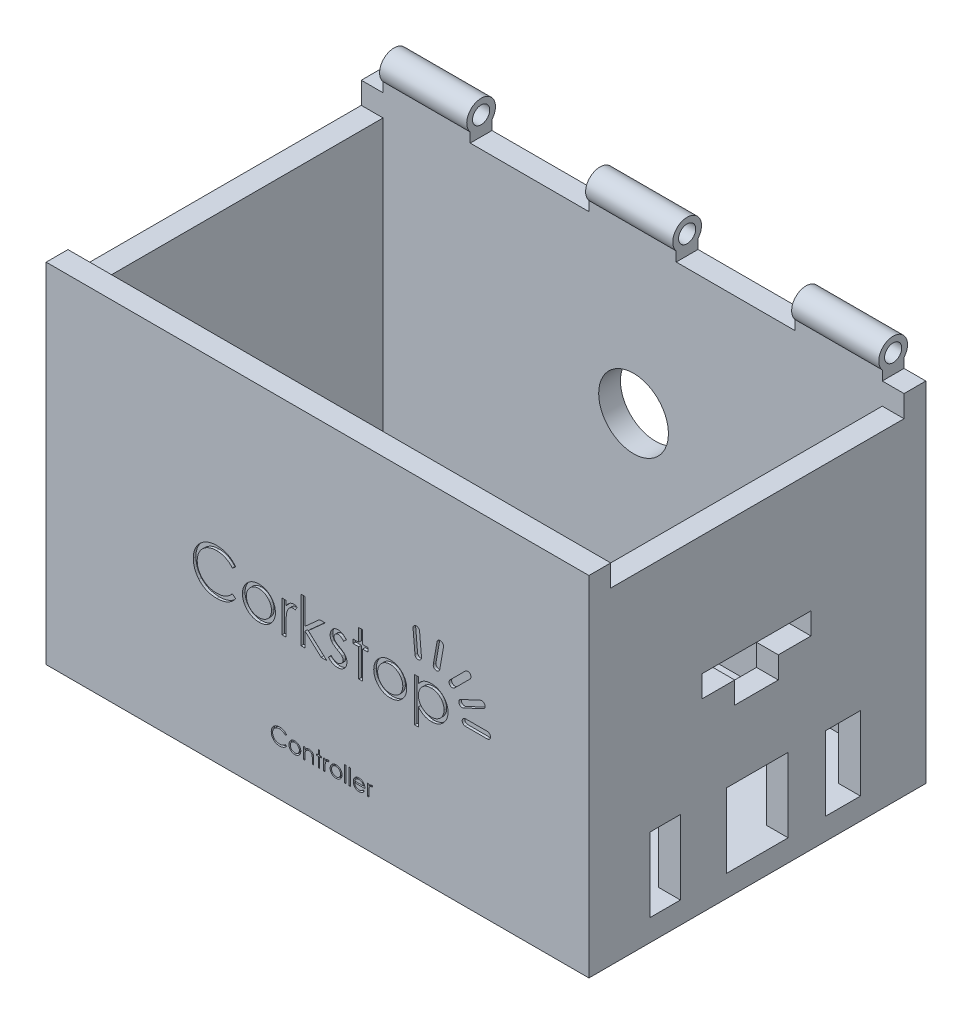
from build123d import *

# Parameters (mm, degrees)
SKETCH1_W                   = 158.2
SKETCH1_H                   = 98.2
BOSS_EXTRUDE1_DEPTH         = 6.35
SKETCH2_W                   = 158.2
SKETCH2_H                   = 95.25
BOSS_EXTRUDE2_DEPTH         = 6.35
SKETCH3_W                   = 85.5
SKETCH3_H                   = 95.25
BOSS_EXTRUDE3_DEPTH         = 6.35
SKETCH4_W                   = 158.2
SKETCH4_H                   = 95.25
BOSS_EXTRUDE4_DEPTH         = 6.35
SKETCH5_W                   = 85.5
SKETCH5_H                   = 73.66
BOSS_EXTRUDE5_DEPTH         = 6.35
SKETCH6_W                   = 13.462
SKETCH6_H                   = 21.59
SKETCH6_W_2                 = 10.922
SKETCH6_W_3                 = 11.43
SKETCH6_W_4                 = 12.7
BOSS_EXTRUDE6_DEPTH         = 6.35
KES_EKSTR_ZYON1_DEPTH       = 6.35
IZIM3_R                     = 10.16
KES_EKSTR_ZYON2_DEPTH       = 6.35
IZIM4_R                     = 4.826
KES_EKSTR_ZYON3_DEPTH       = 6.35
IZIM5_W                     = 85.5
IZIM5_H                     = 6.35
KES_EKSTR_ZYON4_DEPTH       = 6.35
IZIM6_W                     = 85.5
IZIM6_H                     = 6.35
KES_EKSTR_ZYON5_DEPTH       = 6.35
KES_EKSTR_ZYON6_DEPTH       = 0.762
KES_EKSTR_ZYON7_DEPTH       = 0.762
KES_EKSTR_ZYON8_DEPTH       = 0.762
KES_EKSTR_ZYON9_DEPTH       = 0.762
KES_EKSTR_ZYON12_DEPTH      = 0.762
KES_EKSTR_ZYON13_DEPTH      = 0.762
Y_KSEKLIK_EKSTR_ZYON2_DEPTH = 25.4
Y_KSEKLIK_EKSTR_ZYON3_DEPTH = 25.4
Y_KSEKLIK_EKSTR_ZYON4_DEPTH = 25.4
Y_KSEKLIK_EKSTR_ZYON5_DEPTH = 12.7
IZIM24_R                    = 2.5
KES_EKSTR_ZYON14_DEPTH      = 25.4
IZIM25_R                    = 2.5
KES_EKSTR_ZYON15_DEPTH      = 25.4
IZIM26_R                    = 2.5
KES_EKSTR_ZYON16_DEPTH      = 25.4
IZIM27_W                    = 0.410307692
IZIM27_H                    = 4.689230769
KES_EKSTR_ZYON17_DEPTH      = 0.762


with BuildPart() as part:
    # Sketch1 → Boss-Extrude1 (new body)
    with BuildSketch(Plane(origin=(0, 0, 0), x_dir=(1, 0, 0), z_dir=(0, 1, 0))):
        Rectangle(SKETCH1_W, SKETCH1_H)
    extrude(amount=BOSS_EXTRUDE1_DEPTH)

    # Sketch2 → Boss-Extrude2 (add)
    with BuildSketch(Plane.XY.offset(49.1)):
        with Locations((0, 53.975)):
            Rectangle(SKETCH2_W, SKETCH2_H)
    extrude(amount=-BOSS_EXTRUDE2_DEPTH)

    # Sketch3 → Boss-Extrude3 (add)
    with BuildSketch(Plane.ZY.offset(79.1)):
        with Locations((0, 53.975)):
            Rectangle(SKETCH3_W, SKETCH3_H)
    extrude(amount=-BOSS_EXTRUDE3_DEPTH)

    # Sketch4 → Boss-Extrude4 (add)
    with BuildSketch(Plane(origin=(0, 0, -49.1), x_dir=(-1, 0, 0), z_dir=(0, 0, -1))):
        with Locations((0, 53.975)):
            Rectangle(SKETCH4_W, SKETCH4_H)
    extrude(amount=-BOSS_EXTRUDE4_DEPTH)

    # Sketch5 → Boss-Extrude5 (add)
    with BuildSketch(Plane(origin=(79.1, 0, 0), x_dir=(0, 0, -1), z_dir=(1, 0, 0))):
        with Locations((0, 64.77)):
            Rectangle(SKETCH5_W, SKETCH5_H)
    extrude(amount=-BOSS_EXTRUDE5_DEPTH)

    # Sketch6 → Boss-Extrude6 (add)
    with BuildSketch(Plane(origin=(79.1, 0, 0), x_dir=(0, 0, -1), z_dir=(1, 0, 0))):
        with Locations((-15.699, 17.145)):
            Rectangle(SKETCH6_W, SKETCH6_H)
        with Locations((14.429, 17.145)):
            Rectangle(SKETCH6_W_2, SKETCH6_H)
        with Locations((-37.035, 17.145)):
            Rectangle(SKETCH6_W_3, SKETCH6_H)
        with Locations((36.4, 17.145)):
            Rectangle(SKETCH6_W_4, SKETCH6_H)
    extrude(amount=-BOSS_EXTRUDE6_DEPTH)

    # Çizim2 → Kes-Ekstrüzyon1 (cut)
    with BuildSketch(Plane(origin=(79.1, 0, 0), x_dir=(0, 0, -1), z_dir=(1, 0, 0))):
        Polygon((-16.125, 60.325), (15.625, 60.325), (15.625, 53.975), (6.10000009, 53.975), (6.10000009, 47.625), (-6.59999991, 47.625), (-6.59999991, 53.975), (-16.125, 53.975), align=None)
    extrude(amount=-KES_EKSTR_ZYON1_DEPTH, mode=Mode.SUBTRACT)

    # Çizim3 → Kes-Ekstrüzyon2 (cut)
    with BuildSketch(Plane(origin=(0, 0, -49.1), x_dir=(-1, 0, 0), z_dir=(0, 0, -1))):
        with Locations((-0.250018, 57.15)):
            Circle(IZIM3_R)
    extrude(amount=-KES_EKSTR_ZYON2_DEPTH, mode=Mode.SUBTRACT)

    # Çizim4 → Kes-Ekstrüzyon3 (cut)
    with BuildSketch(Plane.ZY.offset(79.1)):
        with Locations((0, 41.275)):
            Circle(IZIM4_R)
    extrude(amount=-KES_EKSTR_ZYON3_DEPTH, mode=Mode.SUBTRACT)

    # Çizim5 → Kes-Ekstrüzyon4 (cut)
    with BuildSketch(Plane(origin=(79.1, 0, 0), x_dir=(0, 0, -1), z_dir=(1, 0, 0))):
        with Locations((0, 98.425)):
            Rectangle(IZIM5_W, IZIM5_H)
    extrude(amount=-KES_EKSTR_ZYON4_DEPTH, mode=Mode.SUBTRACT)

    # Çizim6 → Kes-Ekstrüzyon5 (cut)
    with BuildSketch(Plane.ZY.offset(79.1)):
        with Locations((0, 98.425)):
            Rectangle(IZIM6_W, IZIM6_H)
    extrude(amount=-KES_EKSTR_ZYON5_DEPTH, mode=Mode.SUBTRACT)

    # Çizim7 → Kes-Ekstrüzyon6 (cut)
    # profile 1 of 8: a face of its own
    with BuildSketch(Plane.XY.offset(49.1)):
        with BuildLine():
            Line((-23.838717949, 52.27963141), (-24.83599359, 51.516410256))
            add(Edge.make_bspline(
                [(-24.83599359, 51.516410256), (-24.907134956, 51.601195347), (-25.048458549, 51.769622441), (-25.275821941, 52.006131074), (-25.512773616, 52.227710737), (-25.759222999, 52.435416986), (-26.01960609, 52.621986393), (-26.287615274, 52.797141538), (-26.567733895, 52.954141615), (-26.955090189, 53.144507308), (-27.461812381, 53.343157642), (-28.099696512, 53.509720795), (-28.765579641, 53.615751919), (-29.219868074, 53.627235772), (-29.4509375, 53.633076923)],
                knots=[0, 0, 0, 0, 0.757959112, 1.505699292, 2.245454638, 2.979532153, 3.711538275, 4.438200793, 5.171680507, 5.909471876, 7.393775596, 8.890124382, 10.418191784, 12, 12, 12, 12], degree=3))
            add(Edge.make_bspline(
                [(-29.4509375, 53.633076923), (-29.578239758, 53.631611116), (-29.831662788, 53.628693107), (-30.207758677, 53.590197138), (-30.576831749, 53.536090747), (-30.938641926, 53.455807432), (-31.292728661, 53.354306785), (-31.641406806, 53.233020283), (-31.979628125, 53.082961293), (-32.312071447, 52.917105607), (-32.630584584, 52.729771736), (-32.931955757, 52.525434716), (-33.215085812, 52.306381138), (-33.480198719, 52.07178998), (-33.727565503, 51.822717724), (-33.955393745, 51.55650997), (-34.162895091, 51.274017797), (-34.354182582, 50.97896629), (-34.525497357, 50.672214875), (-34.668934348, 50.352628191), (-34.795952934, 50.025679017), (-34.896461615, 49.687673376), (-34.97601629, 49.340989626), (-35.030908097, 48.984697338), (-35.068966264, 48.619540843), (-35.071869763, 48.37203848), (-35.073333333, 48.247279647)],
                knots=[0, 0, 0, 0, 1.054917814, 2.100044995, 3.131103042, 4.146048494, 5.169673617, 6.183595914, 7.203665975, 8.234915748, 9.262203917, 10.264457458, 11.251630812, 12.227803204, 13.197192746, 14.159520551, 15.12972552, 16.100847026, 17.073214652, 18.039054194, 19.002613845, 19.979014051, 20.95965708, 21.949030935, 22.966165397, 24, 24, 24, 24], degree=3))
            add(Edge.make_bspline(
                [(-35.073333333, 48.247279647), (-35.068754733, 48.059568858), (-35.059765258, 47.691023622), (-34.979761303, 47.151198835), (-34.858185686, 46.63405239), (-34.675974878, 46.142816962), (-34.451297181, 45.671435206), (-34.167395533, 45.227882795), (-33.838586955, 44.805456975), (-33.460219776, 44.414141136), (-33.0450901, 44.056677047), (-32.599690535, 43.741896366), (-32.125130406, 43.479496649), (-31.62664949, 43.261143929), (-31.100411877, 43.093298089), (-30.54736388, 42.97513684), (-29.968708354, 42.898058071), (-29.573305103, 42.890678689), (-29.372071314, 42.886923077)],
                knots=[0, 0, 0, 0, 1.029171465, 2.020641659, 2.987623507, 3.938342917, 4.889210282, 5.84687017, 6.821220943, 7.821438502, 8.827599549, 9.822697543, 10.807740252, 11.797342354, 12.80366471, 13.83203677, 14.896651826, 16, 16, 16, 16], degree=3))
            add(Edge.make_bspline(
                [(-29.372071314, 42.886923077), (-29.150355843, 42.893050935), (-28.713966756, 42.905112025), (-28.074002775, 43.007289872), (-27.461370139, 43.172962888), (-26.876035897, 43.404821063), (-26.319650181, 43.706229394), (-25.791342299, 44.071618835), (-25.290666314, 44.504465071), (-24.98959909, 44.834966708), (-24.83599359, 45.003589744)],
                knots=[0, 0, 0, 0, 1.028121516, 2.023589091, 2.998037872, 3.967518031, 4.937445131, 5.927275754, 6.942489185, 8, 8, 8, 8], degree=3))
            Line((-24.83599359, 45.003589744), (-23.838717949, 44.248000801))
            add(Edge.make_bspline(
                [(-23.838717949, 44.248000801), (-23.91897509, 44.14444699), (-24.079104946, 43.937835384), (-24.338395465, 43.646563752), (-24.611544516, 43.372591966), (-24.900580949, 43.118128883), (-25.202179793, 42.87808268), (-25.521756469, 42.659273177), (-25.855109816, 42.458646254), (-26.201110353, 42.274942843), (-26.559390463, 42.111957403), (-26.929520841, 41.97242516), (-27.309906072, 41.852229133), (-27.700563545, 41.753343534), (-28.102303577, 41.676159886), (-28.51367644, 41.624562781), (-28.935569988, 41.589213548), (-29.220200287, 41.585991682), (-29.364439103, 41.584358974)],
                knots=[0, 0, 0, 0, 0.986787822, 1.968848986, 2.935600012, 3.899624008, 4.868462664, 5.837806735, 6.815139263, 7.798259679, 8.787526145, 9.778297419, 10.776456485, 11.791383307, 12.812564526, 13.85620153, 14.913611965, 16, 16, 16, 16], degree=3))
            add(Edge.make_bspline(
                [(-29.364439103, 41.584358974), (-29.501031837, 41.585309633), (-29.771127056, 41.587189443), (-30.169902526, 41.617641022), (-30.558121862, 41.65918721), (-30.934675504, 41.721744257), (-31.301618328, 41.795565148), (-31.655623877, 41.894520851), (-32.000175641, 42.005370684), (-32.333889334, 42.135654493), (-32.657048816, 42.282670355), (-32.968611789, 42.448828297), (-33.268434958, 42.632731064), (-33.559466056, 42.830324958), (-33.83740586, 43.047956882), (-34.104662938, 43.282604385), (-34.362735923, 43.533476595), (-34.522402809, 43.714378492), (-34.602680288, 43.805332532)],
                knots=[0, 0, 0, 0, 1.114604814, 2.203992996, 3.262667896, 4.300477797, 5.318619304, 6.316056647, 7.298880507, 8.271930387, 9.238335007, 10.195173496, 11.151986948, 12.108099108, 13.064862484, 14.031167946, 15.010108607, 16, 16, 16, 16], degree=3))
            add(Edge.make_bspline(
                [(-34.602680288, 43.805332532), (-34.731261052, 43.963324846), (-34.986870239, 44.277402052), (-35.31389772, 44.786439756), (-35.593833134, 45.317910114), (-35.820168618, 45.874605284), (-35.997107679, 46.455276089), (-36.119685158, 47.060215241), (-36.199338123, 47.688857774), (-36.208446885, 48.116436979), (-36.213076923, 48.333778045)],
                knots=[0, 0, 0, 0, 0.994628077, 1.977248131, 2.950237994, 3.925870899, 4.908910175, 5.911660606, 6.938484602, 8, 8, 8, 8], degree=3))
            add(Edge.make_bspline(
                [(-36.213076923, 48.333778045), (-36.207433792, 48.562216405), (-36.196331284, 49.011654617), (-36.102003684, 49.67123439), (-35.950261195, 50.30315518), (-35.734735342, 50.906237339), (-35.461484496, 51.483652928), (-35.123930783, 52.030991014), (-34.725995724, 52.551751972), (-34.270800264, 53.03803407), (-33.771627361, 53.482676864), (-33.237070522, 53.873859375), (-32.668176029, 54.19940579), (-32.071211253, 54.471534722), (-31.441706066, 54.680701774), (-30.781003555, 54.827126194), (-30.090345207, 54.918265445), (-29.619130119, 54.929786913), (-29.379703526, 54.935641026)],
                knots=[0, 0, 0, 0, 1.032925535, 2.032216505, 3.007276963, 3.968222605, 4.92396291, 5.891752235, 6.871517503, 7.883894988, 8.900124299, 9.891468569, 10.874487609, 11.85992873, 12.854644235, 13.869047385, 14.917252991, 16, 16, 16, 16], degree=3))
            add(Edge.make_bspline(
                [(-29.379703526, 54.935641026), (-29.233782442, 54.933891553), (-28.944946352, 54.930428647), (-28.517672441, 54.896660646), (-28.101684569, 54.840368418), (-27.696696149, 54.76374725), (-27.300736941, 54.668652112), (-26.91683321, 54.544771601), (-26.542732261, 54.403124759), (-26.18079348, 54.239989754), (-25.832753426, 54.056867578), (-25.498720499, 53.85578803), (-25.181348012, 53.637000393), (-24.878402762, 53.402365442), (-24.59495251, 53.146919241), (-24.322949431, 52.877687964), (-24.071630662, 52.586916659), (-23.91649764, 52.382247328), (-23.838717949, 52.27963141)],
                knots=[0, 0, 0, 0, 1.096760587, 2.17092713, 3.219439832, 4.250915756, 5.268269357, 6.278326846, 7.281116186, 8.274029601, 9.260640565, 10.235837813, 11.203064059, 12.156899882, 13.114053108, 14.069676657, 15.032185724, 16, 16, 16, 16], degree=3))
        make_face()
    # profile 2 of 8: a face of its own
    with BuildSketch(Plane.XY.offset(49.1)):
        with BuildLine():
            add(Edge.make_bspline(
                [(-17.076578526, 51.353589744), (-16.902438764, 51.349881739), (-16.56099325, 51.342611247), (-16.060947492, 51.264905514), (-15.58362657, 51.146079364), (-15.127202387, 50.981808267), (-14.697520401, 50.761619475), (-14.288321887, 50.49887719), (-13.90072874, 50.187608922), (-13.668416605, 49.946823931), (-13.550496795, 49.824603365)],
                knots=[0, 0, 0, 0, 1.054011418, 2.066658804, 3.057071809, 4.030435133, 4.997543892, 5.974964718, 6.972108034, 8, 8, 8, 8], degree=3))
            add(Edge.make_bspline(
                [(-13.550496795, 49.824603365), (-13.448962276, 49.707712617), (-13.24785821, 49.476193278), (-12.989991174, 49.100797197), (-12.76784437, 48.712031689), (-12.589815911, 48.304734246), (-12.44944454, 47.88246044), (-12.349783299, 47.443758856), (-12.290503564, 46.989598339), (-12.282509941, 46.681155841), (-12.278461538, 46.52494391)],
                knots=[0, 0, 0, 0, 1.025258237, 2.030674902, 3.01204498, 3.988269485, 4.97094183, 5.956517959, 6.965070386, 8, 8, 8, 8], degree=3))
            add(Edge.make_bspline(
                [(-12.278461538, 46.52494391), (-12.282022391, 46.367826558), (-12.289058802, 46.057355343), (-12.355619924, 45.600085073), (-12.459147007, 45.15669243), (-12.607308248, 44.729033742), (-12.797293388, 44.315801768), (-13.029125311, 43.918801403), (-13.304430893, 43.537249377), (-13.616502539, 43.174385564), (-13.961405061, 42.83995387), (-14.33556937, 42.548477006), (-14.731642579, 42.298753189), (-15.154891318, 42.097598196), (-15.601450484, 41.938994426), (-16.072283274, 41.827597223), (-16.566658244, 41.760244828), (-16.904214161, 41.751595862), (-17.076578526, 41.747179487)],
                knots=[0, 0, 0, 0, 0.998656419, 1.973391657, 2.932242238, 3.890759089, 4.846373663, 5.82037756, 6.809684879, 7.83454468, 8.860553229, 9.859544525, 10.845671541, 11.83227036, 12.833544569, 13.85385346, 14.904124723, 16, 16, 16, 16], degree=3))
            add(Edge.make_bspline(
                [(-17.076578526, 41.747179487), (-17.249787365, 41.751610685), (-17.589025627, 41.760289409), (-18.085145619, 41.82733555), (-18.556822236, 41.938943086), (-19.003966008, 42.098119417), (-19.429034453, 42.298759619), (-19.827402599, 42.547722035), (-20.201870864, 42.840040313), (-20.54684635, 43.174362142), (-20.858898432, 43.537255412), (-21.134209062, 43.918799837), (-21.366039674, 44.315802176), (-21.556025157, 44.729033633), (-21.704186307, 45.15669246), (-21.807713415, 45.600085065), (-21.87427453, 46.057355345), (-21.881310942, 46.367826559), (-21.884871795, 46.52494391)],
                knots=[0, 0, 0, 0, 1.099876186, 2.154163076, 3.173186993, 4.173200201, 5.163417411, 6.152872554, 7.150605724, 8.17532212, 9.198891216, 10.186952605, 11.159729845, 12.11414092, 13.071450619, 14.029093627, 15.002601286, 16, 16, 16, 16], degree=3))
            add(Edge.make_bspline(
                [(-21.884871795, 46.52494391), (-21.880795783, 46.680306805), (-21.87272598, 46.987898637), (-21.813505847, 47.4412054), (-21.714233371, 47.879164497), (-21.573693732, 48.299808367), (-21.394024325, 48.70532095), (-21.17499908, 49.095047051), (-20.914501642, 49.468745641), (-20.714197418, 49.69996576), (-20.612836538, 49.816971154)],
                knots=[0, 0, 0, 0, 1.031353054, 2.041901799, 3.029428768, 4.008703097, 4.981709435, 5.96992636, 6.972712378, 8, 8, 8, 8], degree=3))
            add(Edge.make_bspline(
                [(-20.612836538, 49.816971154), (-20.495094508, 49.940251648), (-20.263534088, 50.182704431), (-19.874011562, 50.493065304), (-19.465819696, 50.761275058), (-19.03138925, 50.977088754), (-18.575340023, 51.147045661), (-18.095573057, 51.265211959), (-17.593830472, 51.342331276), (-17.250714133, 51.349799521), (-17.076578526, 51.353589744)],
                knots=[0, 0, 0, 0, 1.027980169, 2.021703884, 2.998553061, 3.971491411, 4.943284454, 5.930300938, 6.949603206, 8, 8, 8, 8], degree=3))
        make_face()
        with BuildLine():
            add(Edge.make_bspline(
                [(-17.081666667, 50.213846154), (-17.204811713, 50.210346064), (-17.447922837, 50.203436239), (-17.805771045, 50.150880356), (-18.150268175, 50.067613698), (-18.482067809, 49.949307551), (-18.800051035, 49.79654869), (-19.104522295, 49.608921211), (-19.396377148, 49.388910198), (-19.66990635, 49.136859932), (-19.920939311, 48.86152758), (-20.140387969, 48.568163535), (-20.326987641, 48.261526222), (-20.482436217, 47.94129677), (-20.598213728, 47.604230011), (-20.682298696, 47.254143149), (-20.734804997, 46.890322923), (-20.741649856, 46.6429958), (-20.745128205, 46.517311699)],
                knots=[0, 0, 0, 0, 1.021534396, 2.016698045, 2.994645724, 3.958388632, 4.93408049, 5.916473867, 6.921342795, 7.962252576, 8.998418191, 10.008913653, 10.997312074, 11.973003931, 12.956656626, 13.948281152, 14.957379055, 16, 16, 16, 16], degree=3))
            add(Edge.make_bspline(
                [(-20.745128205, 46.517311699), (-20.739297731, 46.354925772), (-20.72772533, 46.032620072), (-20.633617472, 45.557962569), (-20.476187256, 45.102279849), (-20.263599127, 44.668243248), (-19.997239419, 44.266660982), (-19.68341492, 43.908624453), (-19.325493721, 43.599521652), (-18.927742421, 43.343051155), (-18.498285324, 43.13927147), (-18.043783816, 42.994858044), (-17.569744726, 42.90098076), (-17.245783216, 42.891649982), (-17.081666667, 42.886923077)],
                knots=[0, 0, 0, 0, 1.016792936, 2.018143844, 3.017858371, 4.030088057, 5.03801393, 6.028138512, 7.003788237, 7.991172063, 8.984598303, 9.972568034, 10.972917682, 12, 12, 12, 12], degree=3))
            add(Edge.make_bspline(
                [(-17.081666667, 42.886923077), (-16.917559557, 42.891677522), (-16.59361668, 42.901062666), (-16.120236238, 42.99438524), (-15.666976969, 43.139904238), (-15.237965934, 43.342821971), (-14.840395687, 43.60049559), (-14.479900304, 43.906879015), (-14.168755344, 44.267609276), (-13.90265912, 44.668775166), (-13.686589511, 45.101606958), (-13.529896179, 45.558046672), (-13.435562081, 46.032598653), (-13.424020217, 46.354918596), (-13.418205128, 46.517311699)],
                knots=[0, 0, 0, 0, 1.02726834, 2.027799167, 3.010890988, 4.004497153, 4.992059811, 5.971914811, 6.958719428, 7.966827853, 8.981595046, 9.981490638, 10.983022906, 12, 12, 12, 12], degree=3))
            add(Edge.make_bspline(
                [(-13.418205128, 46.517311699), (-13.421682279, 46.642996551), (-13.428524782, 46.890325153), (-13.481048224, 47.254134627), (-13.565069754, 47.604261278), (-13.681081051, 47.941181404), (-13.835854187, 48.262355348), (-14.026052265, 48.567263215), (-14.244604843, 48.862543825), (-14.498666967, 49.135969893), (-14.771910652, 49.389008454), (-15.063883791, 49.609006524), (-15.36790357, 49.795724085), (-15.684962999, 49.950614158), (-16.016805173, 50.066537364), (-16.360819613, 50.151361142), (-16.717141009, 50.203214141), (-16.959380966, 50.210279483), (-17.081666667, 50.213846154)],
                knots=[0, 0, 0, 0, 1.042956736, 2.052379634, 3.044323526, 4.02829302, 5.004299113, 5.996692471, 7.007513377, 8.048758398, 9.090003419, 10.095195979, 11.07790575, 12.047570684, 13.018257071, 13.989683339, 14.985167495, 16, 16, 16, 16], degree=3))
        make_face(mode=Mode.SUBTRACT)
    # profile 3 of 8: a face of its own
    with BuildSketch(Plane.XY.offset(49.1)):
        with BuildLine():
            Line((-10.324615385, 51.190769231), (-9.184871795, 51.190769231))
            Line((-9.184871795, 51.190769231), (-9.184871795, 49.824603365))
            add(Edge.make_bspline(
                [(-9.184871795, 49.824603365), (-9.100729727, 49.951805942), (-8.939808677, 50.195079883), (-8.672336048, 50.516822775), (-8.398366817, 50.783214515), (-8.116589423, 50.995498712), (-7.824931746, 51.154477743), (-7.529794807, 51.270929613), (-7.226535245, 51.339790157), (-7.022747692, 51.34898372), (-6.920649038, 51.353589744)],
                knots=[0, 0, 0, 0, 1.2804753, 2.448899062, 3.506932113, 4.484331642, 5.4025378, 6.288909075, 7.142734305, 8, 8, 8, 8], degree=3))
            add(Edge.make_bspline(
                [(-6.920649038, 51.353589744), (-6.841450654, 51.349269833), (-6.67849483, 51.340381336), (-6.431815147, 51.277930629), (-6.177657479, 51.178224662), (-6.013855102, 51.084461568), (-5.928461538, 51.035580929)],
                knots=[0, 0, 0, 0, 0.901110191, 1.854092781, 2.881294221, 4, 4, 4, 4], degree=3))
            Line((-5.928461538, 51.035580929), (-6.554302885, 50.048481571))
            add(Edge.make_bspline(
                [(-6.554302885, 50.048481571), (-6.609127047, 50.072939108), (-6.713193803, 50.119364195), (-6.865428943, 50.17430806), (-7.005786936, 50.206660098), (-7.095207848, 50.211561272), (-7.136895032, 50.213846154)],
                knots=[0, 0, 0, 0, 1.180555205, 2.24091978, 3.179933427, 4, 4, 4, 4], degree=3))
            add(Edge.make_bspline(
                [(-7.136895032, 50.213846154), (-7.228355837, 50.207750018), (-7.414909366, 50.195315669), (-7.688810264, 50.097566281), (-7.954592981, 49.939631838), (-8.165673013, 49.764476661), (-8.329112045, 49.595574653), (-8.445735149, 49.44807902), (-8.552715402, 49.2826937), (-8.654933059, 49.102245991), (-8.748065041, 48.903654835), (-8.834986269, 48.688904318), (-8.913577, 48.457745708), (-8.958390743, 48.296700563), (-8.981346154, 48.214206731)],
                knots=[0, 0, 0, 0, 1.125678352, 2.296057538, 3.5422874, 4.923748041, 5.663163013, 6.437101912, 7.23742474, 8.08941207, 8.991984279, 9.93940061, 10.944477711, 12, 12, 12, 12], degree=3))
            add(Edge.make_bspline(
                [(-8.981346154, 48.214206731), (-8.998517981, 48.140629558), (-9.036552274, 47.977661712), (-9.073532997, 47.704254208), (-9.110070962, 47.381225503), (-9.135821549, 47.007676437), (-9.159690444, 46.584539855), (-9.173152743, 46.111171138), (-9.18441271, 45.587084407), (-9.184714124, 45.220691754), (-9.184871795, 45.029030449)],
                knots=[0, 0, 0, 0, 0.566838948, 1.255505196, 2.06880316, 3.007127437, 4.065329342, 5.249902469, 6.561414163, 8, 8, 8, 8], degree=3))
            Line((-9.184871795, 45.029030449), (-9.184871795, 41.91))
            Line((-9.184871795, 41.91), (-10.324615385, 41.91))
            Line((-10.324615385, 41.91), (-10.324615385, 51.190769231))
        make_face()
    # profile 4 of 8: a face of its own
    with BuildSketch(Plane.XY.offset(49.1)):
        Polygon((-4.788717949, 54.935641026), (-3.648974359, 54.935641026), (-3.648974359, 47.405192308), (0.574182692, 51.190769231), (2.212564103, 51.190769231), (-2.687315705, 46.794615385), (2.701025641, 41.91), (1.065188301, 41.91), (-3.648974359, 46.186582532), (-3.648974359, 41.91), (-4.788717949, 41.91), align=None)
    # profile 5 of 8: a face of its own
    with BuildSketch(Plane.XY.offset(49.1)):
        with BuildLine():
            Line((8.39974359, 50.033217147), (7.626346154, 49.236923077))
            add(Edge.make_bspline(
                [(7.626346154, 49.236923077), (7.559614898, 49.314259351), (7.430964893, 49.463354582), (7.226924948, 49.662697652), (7.023639301, 49.830108831), (6.823890748, 49.971449884), (6.622656458, 50.078308216), (6.422297926, 50.156303858), (6.222607704, 50.20457041), (6.089126947, 50.210791374), (6.023581731, 50.213846154)],
                knots=[0, 0, 0, 0, 1.26578478, 2.440284043, 3.530471711, 4.527705817, 5.468200915, 6.346673037, 7.188140097, 8, 8, 8, 8], degree=3))
            add(Edge.make_bspline(
                [(6.023581731, 50.213846154), (5.943247373, 50.2099459), (5.785160727, 50.202270754), (5.558644186, 50.125659164), (5.348366204, 50.008061741), (5.16636802, 49.841261452), (5.012198438, 49.649802534), (4.899663081, 49.435730155), (4.830843655, 49.205504397), (4.822117913, 49.045738913), (4.817692308, 48.964707532)],
                knots=[0, 0, 0, 0, 0.99966794, 1.967205029, 2.953328237, 3.988086729, 5.028030931, 6.008226631, 6.989793394, 8, 8, 8, 8], degree=3))
            add(Edge.make_bspline(
                [(4.817692308, 48.964707532), (4.821722969, 48.891366686), (4.82977293, 48.744891741), (4.892353738, 48.528817447), (4.992016342, 48.318153337), (5.085162476, 48.189110791), (5.133157051, 48.122620192)],
                knots=[0, 0, 0, 0, 0.960159726, 1.917612774, 2.927026955, 4, 4, 4, 4], degree=3))
            add(Edge.make_bspline(
                [(5.133157051, 48.122620192), (5.162053157, 48.087116129), (5.223554877, 48.011550205), (5.338974346, 47.906670509), (5.46968457, 47.79076577), (5.626874059, 47.674880675), (5.803770645, 47.552845558), (6.004210334, 47.42946639), (6.221832109, 47.295338334), (6.377633193, 47.210268525), (6.458617788, 47.166049679)],
                knots=[0, 0, 0, 0, 0.66740084, 1.420478572, 2.27185888, 3.217733974, 4.268547843, 5.408967954, 6.65319498, 8, 8, 8, 8], degree=3))
            add(Edge.make_bspline(
                [(6.458617788, 47.166049679), (6.557364197, 47.110732461), (6.748109742, 47.003877809), (7.019137784, 46.838016885), (7.265107904, 46.673165717), (7.488104183, 46.511087323), (7.68383589, 46.347246918), (7.858241552, 46.187924485), (8.006971049, 46.028306138), (8.090261011, 45.91678884), (8.130072115, 45.863485577)],
                knots=[0, 0, 0, 0, 1.27191281, 2.456916733, 3.569705269, 4.599008579, 5.553216877, 6.436649441, 7.252746552, 8, 8, 8, 8], degree=3))
            add(Edge.make_bspline(
                [(8.130072115, 45.863485577), (8.196150315, 45.755840057), (8.327658196, 45.541605495), (8.465755334, 45.188841487), (8.545802617, 44.814697664), (8.556914102, 44.558766465), (8.562564103, 44.428629808)],
                knots=[0, 0, 0, 0, 0.995354457, 1.980940102, 2.973342416, 4, 4, 4, 4], degree=3))
            add(Edge.make_bspline(
                [(8.562564103, 44.428629808), (8.559953223, 44.336938906), (8.554808199, 44.156251967), (8.519037499, 43.890151299), (8.457515156, 43.635663047), (8.37371782, 43.390025871), (8.260563096, 43.15794629), (8.127946803, 42.933569044), (7.968743552, 42.721747809), (7.786983418, 42.522760725), (7.587972625, 42.341021013), (7.375678923, 42.181276952), (7.149840881, 42.048564357), (6.912072201, 41.93874439), (6.661832657, 41.851410997), (6.399083121, 41.790949812), (6.124658783, 41.754762936), (5.938042051, 41.749739265), (5.842952724, 41.747179487)],
                knots=[0, 0, 0, 0, 1.032770009, 2.035186124, 3.017557409, 3.978232242, 4.952395191, 5.920591857, 6.910227898, 7.931268572, 8.952309245, 9.941945286, 10.918353717, 11.897095711, 12.887975737, 13.898235213, 14.929059601, 16, 16, 16, 16], degree=3))
            add(Edge.make_bspline(
                [(5.842952724, 41.747179487), (5.714620402, 41.750781571), (5.459738924, 41.757935689), (5.082767658, 41.825086253), (4.714392333, 41.929572397), (4.35740063, 42.073684501), (4.01977616, 42.255659945), (3.710872519, 42.47360063), (3.429616641, 42.720307192), (3.269530333, 42.909402611), (3.189487179, 43.003950321)],
                knots=[0, 0, 0, 0, 1.013940152, 2.01379169, 3.017749504, 4.037548394, 5.051665909, 6.043208538, 7.021604269, 8, 8, 8, 8], degree=3))
            Line((3.189487179, 43.003950321), (3.945076122, 43.863846154))
            add(Edge.make_bspline(
                [(3.945076122, 43.863846154), (4.016821735, 43.786358865), (4.155911453, 43.63613804), (4.378347297, 43.436115433), (4.60469541, 43.26847082), (4.832695558, 43.12825043), (5.065722757, 43.020208252), (5.302471129, 42.94430364), (5.542459125, 42.895520429), (5.703648018, 42.889793518), (5.784439103, 42.886923077)],
                knots=[0, 0, 0, 0, 1.179806542, 2.287233372, 3.337373186, 4.324005949, 5.273901747, 6.200048787, 7.097828587, 8, 8, 8, 8], degree=3))
            add(Edge.make_bspline(
                [(5.784439103, 42.886923077), (5.894449862, 42.891897213), (6.109392433, 42.90161584), (6.417254072, 42.989852145), (6.701511373, 43.128209399), (6.948338941, 43.32445959), (7.158441069, 43.552898382), (7.310580444, 43.810215329), (7.405925424, 44.088858615), (7.417123191, 44.282015827), (7.422820513, 44.380292468)],
                knots=[0, 0, 0, 0, 1.072336372, 2.095165389, 3.102688358, 4.141489647, 5.156069229, 6.117746104, 7.042326257, 8, 8, 8, 8], degree=3))
            add(Edge.make_bspline(
                [(7.422820513, 44.380292468), (7.418878816, 44.461244513), (7.411096464, 44.621073489), (7.349979448, 44.852396155), (7.253412813, 45.071813259), (7.158327375, 45.200227122), (7.10989984, 45.265629006)],
                knots=[0, 0, 0, 0, 1.013901739, 2.00181326, 2.98231254, 4, 4, 4, 4], degree=3))
            add(Edge.make_bspline(
                [(7.10989984, 45.265629006), (7.080790009, 45.298414463), (7.017378283, 45.36983303), (6.90106355, 45.472975459), (6.761792222, 45.58414799), (6.597997916, 45.70146547), (6.40935044, 45.823380409), (6.195085201, 45.949253201), (5.958137481, 46.085062378), (5.790604048, 46.17512227), (5.703028846, 46.222199519)],
                knots=[0, 0, 0, 0, 0.615000592, 1.339693406, 2.178160186, 3.116406724, 4.166410947, 5.330106347, 6.604359322, 8, 8, 8, 8], degree=3))
            add(Edge.make_bspline(
                [(5.703028846, 46.222199519), (5.608516752, 46.274955797), (5.42522764, 46.377267056), (5.165613184, 46.53661969), (4.931398499, 46.698698087), (4.716947843, 46.854410389), (4.527677908, 47.011966386), (4.364334324, 47.171540984), (4.220486084, 47.326698648), (4.140848333, 47.436634553), (4.102808494, 47.489146635)],
                knots=[0, 0, 0, 0, 1.262093308, 2.447601706, 3.550203992, 4.582594899, 5.537233252, 6.418365656, 7.244515135, 8, 8, 8, 8], degree=3))
            add(Edge.make_bspline(
                [(4.102808494, 47.489146635), (4.037020318, 47.594903581), (3.905420976, 47.80645443), (3.777640139, 48.159552446), (3.689806834, 48.531281654), (3.681960447, 48.787773954), (3.677948718, 48.918914263)],
                knots=[0, 0, 0, 0, 0.985009483, 1.970363186, 2.962279964, 4, 4, 4, 4], degree=3))
            add(Edge.make_bspline(
                [(3.677948718, 48.918914263), (3.679887084, 49.004640707), (3.68368074, 49.172419503), (3.713957728, 49.418940365), (3.769081937, 49.653157952), (3.838224085, 49.878589712), (3.934319558, 50.090868739), (4.049148985, 50.292825848), (4.184086213, 50.484181894), (4.339546154, 50.661993259), (4.510475981, 50.823498529), (4.695151288, 50.964282121), (4.889418676, 51.084410895), (5.094100656, 51.185158763), (5.311163515, 51.26136378), (5.539090002, 51.313823434), (5.777418764, 51.348858027), (5.940345707, 51.35198979), (6.023581731, 51.353589744)],
                knots=[0, 0, 0, 0, 1.087655834, 2.128696564, 3.144119009, 4.137814668, 5.115653402, 6.093965665, 7.082169637, 8.081268856, 9.086088321, 10.061021666, 11.022561449, 11.980240094, 12.950172527, 13.934149372, 14.944599409, 16, 16, 16, 16], degree=3))
            add(Edge.make_bspline(
                [(6.023581731, 51.353589744), (6.122250075, 51.349582564), (6.32143768, 51.341493036), (6.620267323, 51.277246673), (6.918656879, 51.171535124), (7.217373034, 51.025535077), (7.514227513, 50.836606699), (7.811831536, 50.608263241), (8.113757817, 50.342006963), (8.30228501, 50.138446916), (8.39974359, 50.033217147)],
                knots=[0, 0, 0, 0, 0.845714091, 1.707292901, 2.609013841, 3.555613372, 4.552488639, 5.621697636, 6.770543573, 8, 8, 8, 8], degree=3))
        make_face()
    # profile 6 of 8: a face of its own
    with BuildSketch(Plane.XY.offset(49.1)):
        Polygon((11.981794872, 54.935641026), (13.121538462, 54.935641026), (13.121538462, 51.190769231), (14.74974359, 51.190769231), (14.74974359, 50.051025641), (13.121538462, 50.051025641), (13.121538462, 41.91), (11.981794872, 41.91), (11.981794872, 50.051025641), (10.353589744, 50.051025641), (10.353589744, 51.190769231), (11.981794872, 51.190769231), align=None)
    # profile 7 of 8: a face of its own
    with BuildSketch(Plane.XY.offset(49.1)):
        with BuildLine():
            add(Edge.make_bspline(
                [(21.186241987, 51.353589744), (21.360381749, 51.349881739), (21.701827263, 51.342611247), (22.201873021, 51.264905514), (22.679193942, 51.146079364), (23.135618125, 50.981808267), (23.565300112, 50.761619475), (23.974498626, 50.49887719), (24.362091773, 50.187608922), (24.594403907, 49.946823931), (24.712323718, 49.824603365)],
                knots=[0, 0, 0, 0, 1.054011418, 2.066658804, 3.057071809, 4.030435133, 4.997543892, 5.974964718, 6.972108034, 8, 8, 8, 8], degree=3))
            add(Edge.make_bspline(
                [(24.712323718, 49.824603365), (24.813858237, 49.707712617), (25.014962302, 49.476193278), (25.272829339, 49.100797197), (25.494976143, 48.712031689), (25.673004602, 48.304734246), (25.813375973, 47.88246044), (25.913037214, 47.443758856), (25.972316949, 46.989598339), (25.980310572, 46.681155841), (25.984358974, 46.52494391)],
                knots=[0, 0, 0, 0, 1.025258237, 2.030674902, 3.01204498, 3.988269485, 4.97094183, 5.956517959, 6.965070386, 8, 8, 8, 8], degree=3))
            add(Edge.make_bspline(
                [(25.984358974, 46.52494391), (25.980798122, 46.367826558), (25.973761711, 46.057355343), (25.907200589, 45.600085073), (25.803673506, 45.15669243), (25.655512264, 44.729033742), (25.465527125, 44.315801768), (25.233695202, 43.918801403), (24.958389619, 43.537249377), (24.646317974, 43.174385564), (24.301415452, 42.83995387), (23.927251142, 42.548477006), (23.531177934, 42.298753189), (23.107929195, 42.097598196), (22.661370029, 41.938994426), (22.190537239, 41.827597223), (21.696162269, 41.760244828), (21.358606352, 41.751595862), (21.186241987, 41.747179487)],
                knots=[0, 0, 0, 0, 0.998656419, 1.973391657, 2.932242238, 3.890759089, 4.846373663, 5.82037756, 6.809684879, 7.83454468, 8.860553229, 9.859544525, 10.845671541, 11.83227036, 12.833544569, 13.85385346, 14.904124723, 16, 16, 16, 16], degree=3))
            add(Edge.make_bspline(
                [(21.186241987, 41.747179487), (21.013033148, 41.751610685), (20.673794885, 41.760289409), (20.177674894, 41.82733555), (19.705998277, 41.938943086), (19.258854505, 42.098119417), (18.83378606, 42.298759619), (18.435417914, 42.547722035), (18.060949649, 42.840040313), (17.715974163, 43.174362142), (17.403922081, 43.537255412), (17.12861145, 43.918799837), (16.896780838, 44.315802176), (16.706795356, 44.729033633), (16.558634206, 45.15669246), (16.455107098, 45.600085065), (16.388545983, 46.057355345), (16.381509571, 46.367826559), (16.377948718, 46.52494391)],
                knots=[0, 0, 0, 0, 1.099876186, 2.154163076, 3.173186993, 4.173200201, 5.163417411, 6.152872554, 7.150605724, 8.17532212, 9.198891216, 10.186952605, 11.159729845, 12.11414092, 13.071450619, 14.029093627, 15.002601286, 16, 16, 16, 16], degree=3))
            add(Edge.make_bspline(
                [(16.377948718, 46.52494391), (16.38202473, 46.680306805), (16.390094533, 46.987898637), (16.449314666, 47.4412054), (16.548587142, 47.879164497), (16.689126781, 48.299808367), (16.868796188, 48.70532095), (17.087821432, 49.095047051), (17.34831887, 49.468745641), (17.548623095, 49.69996576), (17.649983974, 49.816971154)],
                knots=[0, 0, 0, 0, 1.031353054, 2.041901799, 3.029428768, 4.008703097, 4.981709435, 5.96992636, 6.972712378, 8, 8, 8, 8], degree=3))
            add(Edge.make_bspline(
                [(17.649983974, 49.816971154), (17.767726005, 49.940251648), (17.999286425, 50.182704431), (18.388808951, 50.493065304), (18.797000816, 50.761275058), (19.231431263, 50.977088754), (19.68748049, 51.147045661), (20.167247456, 51.265211959), (20.668990041, 51.342331276), (21.01210638, 51.349799521), (21.186241987, 51.353589744)],
                knots=[0, 0, 0, 0, 1.027980169, 2.021703884, 2.998553061, 3.971491411, 4.943284454, 5.930300938, 6.949603206, 8, 8, 8, 8], degree=3))
        make_face()
        with BuildLine():
            add(Edge.make_bspline(
                [(21.181153846, 50.213846154), (21.058008799, 50.210346064), (20.814897675, 50.203436239), (20.457049468, 50.150880356), (20.112552338, 50.067613698), (19.780752704, 49.949307551), (19.462769478, 49.79654869), (19.158298218, 49.608921211), (18.866443364, 49.388910198), (18.592914163, 49.136859932), (18.341881202, 48.86152758), (18.122432544, 48.568163535), (17.935832872, 48.261526222), (17.780384295, 47.94129677), (17.664606784, 47.604230011), (17.580521817, 47.254143149), (17.528015516, 46.890322923), (17.521170657, 46.6429958), (17.517692308, 46.517311699)],
                knots=[0, 0, 0, 0, 1.021534396, 2.016698045, 2.994645724, 3.958388632, 4.93408049, 5.916473867, 6.921342795, 7.962252576, 8.998418191, 10.008913653, 10.997312074, 11.973003931, 12.956656626, 13.948281152, 14.957379055, 16, 16, 16, 16], degree=3))
            add(Edge.make_bspline(
                [(17.517692308, 46.517311699), (17.523522782, 46.354925772), (17.535095183, 46.032620072), (17.629203041, 45.557962569), (17.786633257, 45.102279849), (17.999221386, 44.668243248), (18.265581094, 44.266660982), (18.579405593, 43.908624453), (18.937326791, 43.599521652), (19.335078092, 43.343051155), (19.764535188, 43.13927147), (20.219036697, 42.994858044), (20.693075786, 42.90098076), (21.017037297, 42.891649982), (21.181153846, 42.886923077)],
                knots=[0, 0, 0, 0, 1.016792936, 2.018143844, 3.017858371, 4.030088057, 5.03801393, 6.028138512, 7.003788237, 7.991172063, 8.984598303, 9.972568034, 10.972917682, 12, 12, 12, 12], degree=3))
            add(Edge.make_bspline(
                [(21.181153846, 42.886923077), (21.345260956, 42.891677522), (21.669203833, 42.901062666), (22.142584275, 42.99438524), (22.595843544, 43.139904238), (23.024854579, 43.342821971), (23.422424826, 43.60049559), (23.782920209, 43.906879015), (24.094065169, 44.267609276), (24.360161393, 44.668775166), (24.576231002, 45.101606958), (24.732924334, 45.558046672), (24.827258431, 46.032598653), (24.838800296, 46.354918596), (24.844615385, 46.517311699)],
                knots=[0, 0, 0, 0, 1.02726834, 2.027799167, 3.010890988, 4.004497153, 4.992059811, 5.971914811, 6.958719428, 7.966827853, 8.981595046, 9.981490638, 10.983022906, 12, 12, 12, 12], degree=3))
            add(Edge.make_bspline(
                [(24.844615385, 46.517311699), (24.841138233, 46.642996551), (24.834295731, 46.890325153), (24.781772288, 47.254134627), (24.697750759, 47.604261278), (24.581739462, 47.941181404), (24.426966326, 48.262355348), (24.236768248, 48.567263215), (24.01821567, 48.862543825), (23.764153546, 49.135969893), (23.49090986, 49.389008454), (23.198936722, 49.609006524), (22.894916942, 49.795724085), (22.577857514, 49.950614158), (22.24601534, 50.066537364), (21.9020009, 50.151361142), (21.545679504, 50.203214141), (21.303439547, 50.210279483), (21.181153846, 50.213846154)],
                knots=[0, 0, 0, 0, 1.042956736, 2.052379634, 3.044323526, 4.02829302, 5.004299113, 5.996692471, 7.007513377, 8.048758398, 9.090003419, 10.095195979, 11.07790575, 12.047570684, 13.018257071, 13.989683339, 14.985167495, 16, 16, 16, 16], degree=3))
        make_face(mode=Mode.SUBTRACT)
    # profile 8 of 8: a face of its own
    with BuildSketch(Plane.XY.offset(49.1)):
        with BuildLine():
            Line((28.263846154, 51.190769231), (29.403589744, 51.190769231))
            Line((29.403589744, 51.190769231), (29.403589744, 49.473521635))
            add(Edge.make_bspline(
                [(29.403589744, 49.473521635), (29.524629757, 49.629324269), (29.759846801, 49.932095509), (30.165248598, 50.323945404), (30.593154448, 50.654418649), (31.054575973, 50.913435268), (31.542341934, 51.108727929), (32.054450629, 51.253070504), (32.595248433, 51.338129569), (32.96498699, 51.348368168), (33.153549679, 51.353589744)],
                knots=[0, 0, 0, 0, 1.0828784, 2.104357462, 3.088488658, 4.04616522, 5.001424249, 5.969181776, 6.964304535, 8, 8, 8, 8], degree=3))
            add(Edge.make_bspline(
                [(33.153549679, 51.353589744), (33.318256354, 51.34882478), (33.643807749, 51.33940658), (34.123008608, 51.275641496), (34.584473571, 51.166357298), (35.025591938, 51.008873976), (35.451089346, 50.814181271), (35.85466668, 50.568465171), (36.242610153, 50.283962707), (36.605163182, 49.956548902), (36.940157859, 49.602297764), (37.22988543, 49.221216832), (37.479792054, 48.825838304), (37.681795702, 48.410032713), (37.840031705, 47.977074364), (37.952570678, 47.525214022), (38.019545556, 47.056127038), (38.028531538, 46.737165737), (38.033076923, 46.575825321)],
                knots=[0, 0, 0, 0, 1.041296284, 2.058176809, 3.050446431, 4.034000596, 5.01514041, 6.003636468, 7.015969324, 8.052561599, 9.08815499, 10.094063707, 11.074456064, 12.040834395, 13.011057502, 13.983766392, 14.980127149, 16, 16, 16, 16], degree=3))
            add(Edge.make_bspline(
                [(38.033076923, 46.575825321), (38.028630161, 46.411079801), (38.019860505, 46.086177862), (37.951842912, 45.609067538), (37.843142254, 45.150099067), (37.686902561, 44.710035853), (37.485003447, 44.28918089), (37.239332613, 43.887837681), (36.949458861, 43.506134816), (36.618166198, 43.149254293), (36.258745544, 42.820508214), (35.874561511, 42.532987219), (35.471576267, 42.291537086), (35.051851546, 42.089850347), (34.611794229, 41.937841564), (34.153457478, 41.828194116), (33.677090833, 41.760577518), (33.353055224, 41.751679744), (33.189166667, 41.747179487)],
                knots=[0, 0, 0, 0, 1.038740735, 2.04854663, 3.033179607, 4.009277356, 4.987731542, 5.972001279, 6.972200261, 8.005528982, 9.039189865, 10.040446548, 11.026516639, 11.997840187, 12.972163198, 13.956796175, 14.96660207, 16, 16, 16, 16], degree=3))
            add(Edge.make_bspline(
                [(33.189166667, 41.747179487), (33.004735191, 41.751877789), (32.640428956, 41.761158314), (32.107763124, 41.855208745), (31.595129975, 41.995768483), (31.108208983, 42.201504831), (30.64314292, 42.463689131), (30.202562482, 42.783403307), (29.784127407, 43.159978717), (29.532272774, 43.445662736), (29.403589744, 43.591630609)],
                knots=[0, 0, 0, 0, 1.014726462, 2.004382257, 2.969841629, 3.936926163, 4.907207904, 5.903978561, 6.929055279, 8, 8, 8, 8], degree=3))
            Line((29.403589744, 43.591630609), (29.403589744, 38.490769231))
            Line((29.403589744, 38.490769231), (28.263846154, 38.490769231))
            Line((28.263846154, 38.490769231), (28.263846154, 51.190769231))
        make_face()
        with BuildLine():
            add(Edge.make_bspline(
                [(33.143373397, 50.213846154), (33.014270414, 50.211522931), (32.760099915, 50.206949105), (32.387546435, 50.152615062), (32.028697311, 50.073738115), (31.687169088, 49.954314934), (31.359688279, 49.807724955), (31.048777167, 49.624547372), (30.754653993, 49.408095808), (30.478058769, 49.162516474), (30.22818339, 48.891916891), (30.006975051, 48.603126841), (29.821165687, 48.296512049), (29.66694407, 47.974928591), (29.549584159, 47.635855699), (29.46628769, 47.281224481), (29.413926124, 46.910646782), (29.40707198, 46.658257844), (29.403589744, 46.530032051)],
                knots=[0, 0, 0, 0, 1.05670511, 2.080379991, 3.077984906, 4.06214886, 5.038337365, 6.01289324, 7.01187578, 8.025460281, 9.038092164, 10.024533457, 11.000252242, 11.969694649, 12.940728589, 13.933144304, 14.949937299, 16, 16, 16, 16], degree=3))
            add(Edge.make_bspline(
                [(29.403589744, 46.530032051), (29.409362279, 46.361709472), (29.420671164, 46.031951282), (29.512609613, 45.550134611), (29.662234714, 45.094198604), (29.874610332, 44.667982841), (30.142934387, 44.276159411), (30.466233412, 43.925310639), (30.841582097, 43.617641923), (31.262740193, 43.358484802), (31.714214781, 43.148070961), (32.185152233, 42.997433683), (32.66907623, 42.904643026), (32.996258419, 42.892861711), (33.161181891, 42.886923077)],
                knots=[0, 0, 0, 0, 1.03728447, 2.032128127, 3.01272805, 3.987917167, 4.958271349, 5.931593992, 6.91984656, 7.941419022, 8.973179163, 9.983609215, 10.983593296, 12, 12, 12, 12], degree=3))
            add(Edge.make_bspline(
                [(33.161181891, 42.886923077), (33.322783106, 42.892570502), (33.643532466, 42.903779624), (34.115820507, 43.000801048), (34.574800824, 43.149010137), (35.010883164, 43.365126242), (35.420271248, 43.629975881), (35.789955742, 43.947693715), (36.112923686, 44.315957224), (36.388202917, 44.726016648), (36.610022878, 45.165710183), (36.776684034, 45.620665508), (36.872872286, 46.0892789), (36.886504061, 46.404956316), (36.893333333, 46.563104968)],
                knots=[0, 0, 0, 0, 1.00104056, 1.986885549, 2.97790532, 3.984399681, 4.995088187, 5.994304198, 6.996462723, 8.023150851, 9.048424203, 10.043036403, 11.019596776, 12, 12, 12, 12], degree=3))
            add(Edge.make_bspline(
                [(36.893333333, 46.563104968), (36.888054728, 46.722235928), (36.877538642, 47.039258059), (36.773953677, 47.50648345), (36.618288043, 47.963276963), (36.391288055, 48.396965815), (36.122043449, 48.806174629), (35.79639006, 49.16741299), (35.431297004, 49.483718003), (35.022396323, 49.745031061), (34.583555351, 49.952895571), (34.121584085, 50.104873347), (33.63882587, 50.196218095), (33.309976952, 50.207918446), (33.143373397, 50.213846154)],
                knots=[0, 0, 0, 0, 0.983928682, 1.960191568, 2.949917689, 3.96440592, 4.982380491, 5.975291189, 6.965713506, 7.964880129, 8.970154049, 9.96478489, 10.968906225, 12, 12, 12, 12], degree=3))
        make_face(mode=Mode.SUBTRACT)
    extrude(amount=-KES_EKSTR_ZYON6_DEPTH, mode=Mode.SUBTRACT)

    # Çizim12 → Kes-Ekstrüzyon7 (cut)
    with BuildSketch(Plane.XY.offset(49.1)):
        with BuildLine():
            Line((27.83710249, 62.676048661), (28.390541456, 56.350212328))
            ThreePointArc((28.390541456, 56.350212328), (29.426927095, 55.48058152), (30.296557903, 56.516967159))
            Line((30.296557903, 56.516967159), (29.743118936, 62.842803492))
            ThreePointArc((29.743118936, 62.842803492), (28.706733297, 63.7124343), (27.83710249, 62.676048661))
        make_face()
    extrude(amount=-KES_EKSTR_ZYON7_DEPTH, mode=Mode.SUBTRACT)

    # Çizim14 → Kes-Ekstrüzyon8 (cut)
    with BuildSketch(Plane.XY.offset(49.1)):
        with BuildLine():
            Line((43.113076923, 47.44838127), (49.463076923, 47.44838127))
            ThreePointArc((49.463076923, 47.44838127), (50.419725505, 46.491732688), (49.463076923, 45.535084106))
            Line((49.463076923, 45.535084106), (43.010121904, 45.535084106))
            ThreePointArc((43.010121904, 45.535084106), (42.155044333, 46.540514653), (43.113076923, 47.44838127))
        make_face()
    extrude(amount=-KES_EKSTR_ZYON8_DEPTH, mode=Mode.SUBTRACT)

    # Çizim15 → Kes-Ekstrüzyon9 (cut)
    with BuildSketch(Plane.XY.offset(49.1)):
        with BuildLine():
            Line((41.714422852, 51.619909819), (47.469477299, 54.303535781))
            ThreePointArc((47.469477299, 54.303535781), (48.740792519, 53.840814882), (48.278071621, 52.569499662))
            Line((48.278071621, 52.569499662), (42.429708238, 49.842363029))
            ThreePointArc((42.429708238, 49.842363029), (41.229831466, 50.392221166), (41.714422852, 51.619909819))
        make_face()
    extrude(amount=-KES_EKSTR_ZYON9_DEPTH, mode=Mode.SUBTRACT)

    # Çizim19 → Kes-Ekstrüzyon12 (cut)
    with BuildSketch(Plane.XY.offset(49.1)):
        with BuildLine():
            Line((33.734932162, 56.471718398), (34.83759809, 62.725247629))
            ThreePointArc((34.83759809, 62.725247629), (35.945833313, 63.501242287), (36.721827971, 62.393007063))
            Line((36.721827971, 62.393007063), (35.601284091, 56.038086931))
            ThreePointArc((35.601284091, 56.038086931), (34.462645631, 55.370591092), (33.734932162, 56.471718398))
        make_face()
    extrude(amount=-KES_EKSTR_ZYON12_DEPTH, mode=Mode.SUBTRACT)

    # Çizim18 → Kes-Ekstrüzyon13 (cut)
    with BuildSketch(Plane.XY.offset(49.1)):
        with BuildLine():
            Line((38.600776561, 54.999793619), (43.090904621, 59.489921679))
            ThreePointArc((43.090904621, 59.489921679), (44.44381002, 59.489921679), (44.44381002, 58.13701628))
            Line((44.44381002, 58.13701628), (39.880881767, 53.574088027))
            ThreePointArc((39.880881767, 53.574088027), (38.565303861, 53.680403637), (38.600776561, 54.999793619))
        make_face()
    extrude(amount=-KES_EKSTR_ZYON13_DEPTH, mode=Mode.SUBTRACT)

    # Çizim21 → Yükseklik-Ekstrüzyon2 (add)
    with BuildSketch(Plane(origin=(-72.75, 0, 0), x_dir=(0, 0, -1), z_dir=(1, 0, 0))):
        with BuildLine():
            Line((42.75, 101.6), (49.1, 101.6))
            Line((49.1, 101.6), (49.1, 104.399660388))
            ThreePointArc((49.1, 104.399660388), (45.925, 111.328237817), (42.75, 104.399660388))
            Line((42.75, 104.399660388), (42.75, 101.6))
        make_face()
    extrude(amount=Y_KSEKLIK_EKSTR_ZYON2_DEPTH)

    # Çizim22 → Yükseklik-Ekstrüzyon3 (add)
    with BuildSketch(Plane.ZY.offset(-72.75)):
        with BuildLine():
            Line((-49.100001733, 101.599988126), (-42.750001733, 101.599988126))
            Line((-42.750001733, 101.599988126), (-42.750001733, 104.399539814))
            ThreePointArc((-42.750001733, 104.399539814), (-45.925001733, 111.328117243), (-49.100001733, 104.399539814))
            Line((-49.100001733, 104.399539814), (-49.100001733, 101.599988126))
        make_face()
    extrude(amount=Y_KSEKLIK_EKSTR_ZYON3_DEPTH)

    # Çizim23 → Yükseklik-Ekstrüzyon4 (add)
    with BuildSketch(Plane.ZY.offset(-12.699999958)):
        with BuildLine():
            Line((-49.100007839, 101.599997519), (-42.750007839, 101.599997519))
            Line((-42.750007839, 101.599997519), (-42.750007839, 104.399657907))
            ThreePointArc((-42.750007839, 104.399657907), (-45.925007839, 111.328235336), (-49.100007839, 104.399657907))
            Line((-49.100007839, 104.399657907), (-49.100007839, 101.599997519))
        make_face()
    extrude(amount=Y_KSEKLIK_EKSTR_ZYON4_DEPTH)

    # Çizim23<2> → Yükseklik-Ekstrüzyon5 (add)
    with BuildSketch(Plane.ZY.offset(-12.699999958)):
        with BuildLine():
            Line((-49.100007839, 101.599997519), (-42.750007839, 101.599997519))
            Line((-42.750007839, 101.599997519), (-42.750007839, 104.399657907))
            ThreePointArc((-42.750007839, 104.399657907), (-45.925007839, 111.328235336), (-49.100007839, 104.399657907))
            Line((-49.100007839, 104.399657907), (-49.100007839, 101.599997519))
        make_face()
    extrude(amount=Y_KSEKLIK_EKSTR_ZYON5_DEPTH)

    # Çizim24 → Kes-Ekstrüzyon14 (cut)
    with BuildSketch(Plane.ZY.offset(-12.699999958)):
        with Locations((-45.925007839, 107.136479468)):
            Circle(IZIM24_R)
    extrude(amount=KES_EKSTR_ZYON14_DEPTH, mode=Mode.SUBTRACT)

    # Çizim25 → Kes-Ekstrüzyon15 (cut)
    with BuildSketch(Plane(origin=(72.75, 0, 0), x_dir=(0, 0, -1), z_dir=(1, 0, 0))):
        with Locations((45.925001733, 107.136361375)):
            Circle(IZIM25_R)
    extrude(amount=-KES_EKSTR_ZYON15_DEPTH, mode=Mode.SUBTRACT)

    # Çizim26 → Kes-Ekstrüzyon16 (cut)
    with BuildSketch(Plane.ZY.offset(72.75)):
        with Locations((-45.925, 107.136481949)):
            Circle(IZIM26_R)
    extrude(amount=-KES_EKSTR_ZYON16_DEPTH, mode=Mode.SUBTRACT)

    # Çizim27 → Kes-Ekstrüzyon17 (cut)
    # profile 1 of 10: a face of its own
    with BuildSketch(Plane.XY.offset(49.1)):
        with BuildLine():
            Line((-9.041037877, 17.329281872), (-9.400057108, 17.054522257))
            add(Edge.make_bspline(
                [(-9.400057108, 17.054522257), (-9.425668, 17.08504489), (-9.476544493, 17.145678644), (-9.558395314, 17.230821751), (-9.643697918, 17.31059043), (-9.732419695, 17.38536468), (-9.826157608, 17.452529666), (-9.922640914, 17.515585518), (-10.023483618, 17.572105546), (-10.162931884, 17.640637196), (-10.345351873, 17.712151316), (-10.57499016, 17.772114051), (-10.814708086, 17.810285255), (-10.978251922, 17.814419443), (-11.061436916, 17.816522257)],
                knots=[0, 0, 0, 0, 0.757959112, 1.505699292, 2.245454638, 2.979532153, 3.711538275, 4.438200793, 5.171680507, 5.909471876, 7.393775596, 8.890124382, 10.418191784, 12, 12, 12, 12], degree=3))
            add(Edge.make_bspline(
                [(-11.061436916, 17.816522257), (-11.107265728, 17.815994567), (-11.198498019, 17.814944083), (-11.33389254, 17.801085534), (-11.466758845, 17.781607234), (-11.597010509, 17.75270524), (-11.724481734, 17.716165007), (-11.850005866, 17.672501867), (-11.971765541, 17.61848063), (-12.091445137, 17.558772583), (-12.206109866, 17.49133239), (-12.314603488, 17.417771063), (-12.416530308, 17.338911774), (-12.511970955, 17.254458958), (-12.601022997, 17.164792945), (-12.683041164, 17.068958154), (-12.757741648, 16.967260972), (-12.826605145, 16.861042429), (-12.888278464, 16.75061192), (-12.939915781, 16.635560713), (-12.985642472, 16.517859011), (-13.021825597, 16.39617698), (-13.05046528, 16.27137083), (-13.070226331, 16.143105606), (-13.083927271, 16.011649268), (-13.08497253, 15.922548418), (-13.085499416, 15.877635238)],
                knots=[0, 0, 0, 0, 1.054917814, 2.100044995, 3.131103042, 4.146048494, 5.169673617, 6.183595914, 7.203665975, 8.234915748, 9.262203917, 10.264457458, 11.251630812, 12.227803204, 13.197192746, 14.159520551, 15.12972552, 16.100847026, 17.073214652, 18.039054194, 19.002613845, 19.979014051, 20.95965708, 21.949030935, 22.966165397, 24, 24, 24, 24], degree=3))
            add(Edge.make_bspline(
                [(-13.085499416, 15.877635238), (-13.08385112, 15.810059354), (-13.080614909, 15.677383068), (-13.051813485, 15.483046145), (-13.008046263, 15.296873425), (-12.942450372, 15.120028671), (-12.861566401, 14.950331239), (-12.759361808, 14.790652371), (-12.640990719, 14.638579076), (-12.504778535, 14.497705374), (-12.355331852, 14.369018302), (-12.194988009, 14.255697256), (-12.024146362, 14.161233358), (-11.844693232, 14.082626379), (-11.655247691, 14.022201877), (-11.456150412, 13.979663827), (-11.247834423, 13.95191547), (-11.105489253, 13.949258893), (-11.033045089, 13.947906872)],
                knots=[0, 0, 0, 0, 1.029171465, 2.020641659, 2.987623507, 3.938342917, 4.889210282, 5.84687017, 6.821220943, 7.821438502, 8.827599549, 9.822697543, 10.807740252, 11.797342354, 12.80366471, 13.83203677, 14.896651826, 16, 16, 16, 16], degree=3))
            add(Edge.make_bspline(
                [(-11.033045089, 13.947906872), (-10.953227519, 13.950112901), (-10.796127448, 13.954454894), (-10.565740415, 13.991238919), (-10.345192666, 14.050881204), (-10.134472339, 14.134350148), (-9.934173481, 14.242857147), (-9.743982643, 14.374397345), (-9.563739289, 14.53022199), (-9.455355088, 14.649202579), (-9.400057108, 14.709906872)],
                knots=[0, 0, 0, 0, 1.028121516, 2.023589091, 2.998037872, 3.967518031, 4.937445131, 5.927275754, 6.942489185, 8, 8, 8, 8], degree=3))
            Line((-9.400057108, 14.709906872), (-9.041037877, 14.437894853))
            add(Edge.make_bspline(
                [(-9.041037877, 14.437894853), (-9.069930448, 14.400615481), (-9.127577196, 14.326235303), (-9.220921783, 14.221377515), (-9.319255441, 14.122747672), (-9.423308557, 14.031140963), (-9.531884141, 13.944724329), (-9.646931745, 13.865952909), (-9.766938949, 13.793727216), (-9.891499143, 13.727593988), (-10.020479982, 13.66891923), (-10.153726918, 13.618687622), (-10.290665602, 13.575417052), (-10.431302292, 13.539818237), (-10.575928704, 13.512032124), (-10.724022934, 13.493457166), (-10.875904611, 13.480731442), (-10.978371519, 13.47957157), (-11.030297493, 13.478983795)],
                knots=[0, 0, 0, 0, 0.986787822, 1.968848986, 2.935600012, 3.899624008, 4.868462664, 5.837806735, 6.815139263, 7.798259679, 8.787526145, 9.778297419, 10.776456485, 11.791383307, 12.812564526, 13.85620153, 14.913611965, 16, 16, 16, 16], degree=3))
            add(Edge.make_bspline(
                [(-11.030297493, 13.478983795), (-11.079470877, 13.479326033), (-11.176705156, 13.480002764), (-11.320264325, 13.490965333), (-11.460023286, 13.50592196), (-11.595582597, 13.528442497), (-11.727682014, 13.555018018), (-11.855124012, 13.590642071), (-11.979162646, 13.630548011), (-12.099299576, 13.677450182), (-12.21563699, 13.730375893), (-12.32779966, 13.790192752), (-12.435736001, 13.856397748), (-12.540507196, 13.92753155), (-12.640565525, 14.005879042), (-12.736778073, 14.090352143), (-12.829684348, 14.180666139), (-12.887164427, 14.245790822), (-12.91606432, 14.278534276)],
                knots=[0, 0, 0, 0, 1.114604814, 2.203992996, 3.262667896, 4.300477797, 5.318619304, 6.316056647, 7.298880507, 8.271930387, 9.238335007, 10.195173496, 11.151986948, 12.108099108, 13.064862484, 14.031167946, 15.010108607, 16, 16, 16, 16], degree=3))
            add(Edge.make_bspline(
                [(-12.91606432, 14.278534276), (-12.962353394, 14.335411509), (-13.054372702, 14.448479304), (-13.172102595, 14.631732877), (-13.272879344, 14.823062206), (-13.354360118, 15.023472467), (-13.41805818, 15.232513957), (-13.462186073, 15.450292052), (-13.49086114, 15.676603364), (-13.494140294, 15.830531877), (-13.495807108, 15.908774661)],
                knots=[0, 0, 0, 0, 0.994628077, 1.977248131, 2.950237994, 3.925870899, 4.908910175, 5.911660606, 6.938484602, 8, 8, 8, 8], degree=3))
            add(Edge.make_bspline(
                [(-13.495807108, 15.908774661), (-13.493775581, 15.99101247), (-13.489778678, 16.152810227), (-13.455820742, 16.390258945), (-13.401193446, 16.61775043), (-13.323604139, 16.834860007), (-13.225233834, 17.042729619), (-13.103714497, 17.23977133), (-12.960457876, 17.427245275), (-12.796587511, 17.60230683), (-12.616885266, 17.762378236), (-12.424444804, 17.90320394), (-12.219642786, 18.020400649), (-12.004735467, 18.118367065), (-11.778113599, 18.193667203), (-11.540260695, 18.246379995), (-11.29162369, 18.279190125), (-11.121986259, 18.283337854), (-11.035792685, 18.285445334)],
                knots=[0, 0, 0, 0, 1.032925535, 2.032216505, 3.007276963, 3.968222605, 4.92396291, 5.891752235, 6.871517503, 7.883894988, 8.900124299, 9.891468569, 10.874487609, 11.85992873, 12.854644235, 13.869047385, 14.917252991, 16, 16, 16, 16], degree=3))
            add(Edge.make_bspline(
                [(-11.035792685, 18.285445334), (-10.983261095, 18.284815524), (-10.879280102, 18.283568878), (-10.725461495, 18.271412397), (-10.575705861, 18.251147195), (-10.429910029, 18.223563575), (-10.287364715, 18.189329325), (-10.149159371, 18.144732341), (-10.01448303, 18.093739478), (-9.884185068, 18.035010876), (-9.758890649, 17.969086893), (-9.638638795, 17.896698255), (-9.5243847, 17.817934706), (-9.41532441, 17.733466124), (-9.313282319, 17.641505491), (-9.215361211, 17.544582232), (-9.124886454, 17.439904562), (-9.069038566, 17.366223603), (-9.041037877, 17.329281872)],
                knots=[0, 0, 0, 0, 1.096760587, 2.17092713, 3.219439832, 4.250915756, 5.268269357, 6.278326846, 7.281116186, 8.274029601, 9.260640565, 10.235837813, 11.203064059, 12.156899882, 13.114053108, 14.069676657, 15.032185724, 16, 16, 16, 16], degree=3))
        make_face()
    # profile 2 of 10: a face of its own
    with BuildSketch(Plane.XY.offset(49.1)):
        with BuildLine():
            add(Edge.make_bspline(
                [(-6.606667685, 16.995906872), (-6.543977371, 16.994571991), (-6.421056986, 16.991954614), (-6.241040513, 16.96398055), (-6.069204981, 16.921203136), (-5.904892275, 16.862065541), (-5.75020676, 16.782797576), (-5.602895295, 16.688210353), (-5.463361762, 16.576153777), (-5.379729394, 16.48947118), (-5.337278262, 16.445471776)],
                knots=[0, 0, 0, 0, 1.054011418, 2.066658804, 3.057071809, 4.030435133, 4.997543892, 5.974964718, 6.972108034, 8, 8, 8, 8], degree=3))
            add(Edge.make_bspline(
                [(-5.337278262, 16.445471776), (-5.300725835, 16.403391107), (-5.228328371, 16.320044145), (-5.135496238, 16.184901556), (-5.055523389, 16.044945973), (-4.991433144, 15.898318893), (-4.94089945, 15.746300323), (-4.905021403, 15.588367753), (-4.883680699, 15.424869967), (-4.880802994, 15.313830668), (-4.87934557, 15.257594372)],
                knots=[0, 0, 0, 0, 1.025258237, 2.030674902, 3.01204498, 3.988269485, 4.97094183, 5.956517959, 6.965070386, 8, 8, 8, 8], degree=3))
            add(Edge.make_bspline(
                [(-4.87934557, 15.257594372), (-4.880627476, 15.201032126), (-4.883160584, 15.089262488), (-4.907122588, 14.924645191), (-4.944392338, 14.76502384), (-4.997730385, 14.611066712), (-5.066125035, 14.462303201), (-5.149584528, 14.31938307), (-5.248694537, 14.18202434), (-5.36104033, 14.051393368), (-5.485205238, 13.930997958), (-5.619904389, 13.826066287), (-5.762490744, 13.736165713), (-5.91486029, 13.663749915), (-6.07562159, 13.606652558), (-6.245121394, 13.566549565), (-6.423096383, 13.542302703), (-6.544616514, 13.539189075), (-6.606667685, 13.53759918)],
                knots=[0, 0, 0, 0, 0.998656419, 1.973391657, 2.932242238, 3.890759089, 4.846373663, 5.82037756, 6.809684879, 7.83454468, 8.860553229, 9.859544525, 10.845671541, 11.83227036, 12.833544569, 13.85385346, 14.904124723, 16, 16, 16, 16], degree=3))
            add(Edge.make_bspline(
                [(-6.606667685, 13.53759918), (-6.669022867, 13.539194411), (-6.791148642, 13.542318752), (-6.969751839, 13.566455363), (-7.139555421, 13.606634076), (-7.300527179, 13.663937555), (-7.453551819, 13.736168027), (-7.596964351, 13.825794497), (-7.731772927, 13.931029077), (-7.855964102, 14.051384936), (-7.968302851, 14.182026513), (-8.067414678, 14.319382506), (-8.150873699, 14.462303348), (-8.219268472, 14.611066673), (-8.272606486, 14.76502385), (-8.309876245, 14.924645188), (-8.333838247, 15.089262489), (-8.336371355, 15.201032126), (-8.337653262, 15.257594372)],
                knots=[0, 0, 0, 0, 1.099876186, 2.154163076, 3.173186993, 4.173200201, 5.163417411, 6.152872554, 7.150605724, 8.17532212, 9.198891216, 10.186952605, 11.159729845, 12.11414092, 13.071450619, 14.029093627, 15.002601286, 16, 16, 16, 16], degree=3))
            add(Edge.make_bspline(
                [(-8.337653262, 15.257594372), (-8.336185898, 15.313525015), (-8.333280769, 15.424258074), (-8.311961521, 15.587448509), (-8.276223429, 15.745113784), (-8.225629159, 15.896545577), (-8.160948173, 16.042530107), (-8.082099085, 16.182831503), (-7.988320007, 16.317362995), (-7.916210486, 16.400602238), (-7.87972057, 16.44272418)],
                knots=[0, 0, 0, 0, 1.031353054, 2.041901799, 3.029428768, 4.008703097, 4.981709435, 5.96992636, 6.972712378, 8, 8, 8, 8], degree=3))
            add(Edge.make_bspline(
                [(-7.87972057, 16.44272418), (-7.837333439, 16.487105158), (-7.753971687, 16.57438816), (-7.613743578, 16.686118074), (-7.466794506, 16.782673586), (-7.310399546, 16.860366516), (-7.146221824, 16.921551003), (-6.973505716, 16.96409087), (-6.792878386, 16.991853824), (-6.669356504, 16.994542392), (-6.606667685, 16.995906872)],
                knots=[0, 0, 0, 0, 1.027980169, 2.021703884, 2.998553061, 3.971491411, 4.943284454, 5.930300938, 6.949603206, 8, 8, 8, 8], degree=3))
        make_face()
        with BuildLine():
            add(Edge.make_bspline(
                [(-6.608499416, 16.58559918), (-6.652831633, 16.584339148), (-6.740351637, 16.581851611), (-6.869176992, 16.562931493), (-6.993195959, 16.532955496), (-7.112643827, 16.490365283), (-7.227117788, 16.435372093), (-7.336727442, 16.367826201), (-7.441795189, 16.288622236), (-7.540265702, 16.19788414), (-7.630637568, 16.098764494), (-7.709639085, 15.993153437), (-7.776814966, 15.882764005), (-7.832776454, 15.767481402), (-7.874456358, 15.646137369), (-7.904726946, 15.520106098), (-7.923629215, 15.389130817), (-7.926093364, 15.300093053), (-7.92734557, 15.254846776)],
                knots=[0, 0, 0, 0, 1.021534396, 2.016698045, 2.994645724, 3.958388632, 4.93408049, 5.916473867, 6.921342795, 7.962252576, 8.998418191, 10.008913653, 10.997312074, 11.973003931, 12.956656626, 13.948281152, 14.957379055, 16, 16, 16, 16], degree=3))
            add(Edge.make_bspline(
                [(-7.92734557, 15.254846776), (-7.925246599, 15.196387842), (-7.921080534, 15.08035779), (-7.887201706, 14.90948109), (-7.830526828, 14.74543531), (-7.753995101, 14.589182134), (-7.658105607, 14.444612518), (-7.545128787, 14.315719368), (-7.416277155, 14.204442359), (-7.273086687, 14.11211298), (-7.118482132, 14.038752294), (-6.95486159, 13.98676346), (-6.784207517, 13.952967638), (-6.667581374, 13.949608558), (-6.608499416, 13.947906872)],
                knots=[0, 0, 0, 0, 1.016792936, 2.018143844, 3.017858371, 4.030088057, 5.03801393, 6.028138512, 7.003788237, 7.991172063, 8.984598303, 9.972568034, 10.972917682, 12, 12, 12, 12], degree=3))
            add(Edge.make_bspline(
                [(-6.608499416, 13.947906872), (-6.549420856, 13.949618473), (-6.43280142, 13.952997124), (-6.262384461, 13.986593251), (-6.099211124, 14.03898009), (-5.944767152, 14.112030474), (-5.801641863, 14.204792977), (-5.671863525, 14.31509101), (-5.559851339, 14.444953904), (-5.464056699, 14.589373625), (-5.38627164, 14.74519307), (-5.32986204, 14.909511367), (-5.295901765, 15.08035008), (-5.291746694, 15.196385259), (-5.289653262, 15.254846776)],
                knots=[0, 0, 0, 0, 1.02726834, 2.027799167, 3.010890988, 4.004497153, 4.992059811, 5.971914811, 6.958719428, 7.966827853, 8.981595046, 9.981490638, 10.983022906, 12, 12, 12, 12], degree=3))
            add(Edge.make_bspline(
                [(-5.289653262, 15.254846776), (-5.290905036, 15.300093323), (-5.293368337, 15.38913162), (-5.312276777, 15.52010303), (-5.342524527, 15.646148625), (-5.384288594, 15.76743987), (-5.440006923, 15.88306249), (-5.508478231, 15.992829322), (-5.587157159, 16.099130342), (-5.678619524, 16.197563726), (-5.776987251, 16.288657608), (-5.88209758, 16.367856913), (-5.991544701, 16.435075235), (-6.105686095, 16.490835662), (-6.225149278, 16.532568016), (-6.348994476, 16.563104576), (-6.477270179, 16.581771655), (-6.564476563, 16.584315178), (-6.608499416, 16.58559918)],
                knots=[0, 0, 0, 0, 1.042956736, 2.052379634, 3.044323526, 4.02829302, 5.004299113, 5.996692471, 7.007513377, 8.048758398, 9.090003419, 10.095195979, 11.07790575, 12.047570684, 13.018257071, 13.989683339, 14.985167495, 16, 16, 16, 16], degree=3))
        make_face(mode=Mode.SUBTRACT)
    # profile 3 of 10: a face of its own
    with BuildSketch(Plane.XY.offset(49.1)):
        with BuildLine():
            Line((-4.058730185, 16.937291488), (-3.648422493, 16.937291488))
            Line((-3.648422493, 16.937291488), (-3.648422493, 16.334652065))
            add(Edge.make_bspline(
                [(-3.648422493, 16.334652065), (-3.604612759, 16.389310616), (-3.519598442, 16.495377441), (-3.378017536, 16.634785003), (-3.228390476, 16.749666594), (-3.071633573, 16.841242179), (-2.907534029, 16.910274972), (-2.737092129, 16.960130582), (-2.559287433, 16.990024707), (-2.438371832, 16.993930802), (-2.377201339, 16.995906872)],
                knots=[0, 0, 0, 0, 1.12780773, 2.188550248, 3.19190651, 4.159438251, 5.104880172, 6.052711206, 7.014878035, 8, 8, 8, 8], degree=3))
            add(Edge.make_bspline(
                [(-2.377201339, 16.995906872), (-2.315374008, 16.993627149), (-2.194363007, 16.989165179), (-2.018173722, 16.953873661), (-1.853616478, 16.893594774), (-1.701278018, 16.811021749), (-1.563951841, 16.708339236), (-1.443349206, 16.588712488), (-1.343596987, 16.451113467), (-1.276718603, 16.323459104), (-1.232663271, 16.210218771), (-1.204927772, 16.113231302), (-1.181374159, 16.005177763), (-1.16095463, 15.886384677), (-1.1471379, 15.756019726), (-1.136240483, 15.614617313), (-1.1284306, 15.462223238), (-1.12812074, 15.356823449), (-1.127960954, 15.302471776)],
                knots=[0, 0, 0, 0, 1.235846778, 2.418850247, 3.575807741, 4.728682307, 5.871620074, 6.994088408, 8.11269785, 9.256955736, 9.865816715, 10.540099792, 11.271859618, 12.076849838, 12.949306005, 13.892391288, 14.913166135, 16, 16, 16, 16], degree=3))
            Line((-1.127960954, 15.302471776), (-1.127960954, 13.596214565))
            Line((-1.127960954, 13.596214565), (-1.538268647, 13.596214565))
            Line((-1.538268647, 13.596214565), (-1.538268647, 15.167839565))
            add(Edge.make_bspline(
                [(-1.538268647, 15.167839565), (-1.538521031, 15.213327627), (-1.539003801, 15.300338549), (-1.540526468, 15.424917741), (-1.544196879, 15.537893923), (-1.549354503, 15.638996999), (-1.556903568, 15.728129885), (-1.564770846, 15.805474117), (-1.57439161, 15.870931496), (-1.582964649, 15.910335712), (-1.586809512, 15.928007834)],
                knots=[0, 0, 0, 0, 1.430800155, 2.736877192, 3.918605307, 4.986035426, 5.920637409, 6.731861385, 7.431261377, 8, 8, 8, 8], degree=3))
            add(Edge.make_bspline(
                [(-1.586809512, 15.928007834), (-1.600689492, 15.979881988), (-1.627404159, 16.079723684), (-1.693415979, 16.215152009), (-1.776775532, 16.330364042), (-1.87853238, 16.424647463), (-1.997703618, 16.498022624), (-2.133958549, 16.548933744), (-2.285982304, 16.580776117), (-2.392907515, 16.583946645), (-2.448638839, 16.58559918)],
                knots=[0, 0, 0, 0, 1.084156227, 2.086665306, 3.027808233, 3.945421172, 4.874247719, 5.839848303, 6.874090471, 8, 8, 8, 8], degree=3))
            add(Edge.make_bspline(
                [(-2.448638839, 16.58559918), (-2.481645653, 16.584977382), (-2.546965285, 16.58374686), (-2.643826334, 16.571400764), (-2.737779854, 16.551207604), (-2.829768767, 16.523947201), (-2.917953234, 16.486506088), (-3.005166474, 16.444013437), (-3.088124452, 16.391045887), (-3.16859609, 16.332014024), (-3.243462992, 16.266596271), (-3.313125038, 16.197566242), (-3.375223275, 16.124054225), (-3.43148327, 16.047244693), (-3.480048705, 15.966082761), (-3.52244171, 15.881351444), (-3.558411195, 15.79293922), (-3.576284701, 15.731576368), (-3.585227781, 15.700873219)],
                knots=[0, 0, 0, 0, 1.023777757, 2.026029729, 3.023749952, 4.003683103, 4.997618607, 5.993177895, 7.010360494, 8.046726602, 9.087585522, 10.09234134, 11.086953743, 12.070360549, 13.043493632, 14.017870808, 15.008233677, 16, 16, 16, 16], degree=3))
            add(Edge.make_bspline(
                [(-3.585227781, 15.700873219), (-3.590374088, 15.678332993), (-3.601577328, 15.629264102), (-3.613677688, 15.548738878), (-3.624660383, 15.455587676), (-3.633852662, 15.349919198), (-3.639476766, 15.231363482), (-3.645608989, 15.100426839), (-3.647841511, 14.956587162), (-3.648223409, 14.856445088), (-3.648422493, 14.804241007)],
                knots=[0, 0, 0, 0, 0.615963638, 1.340920617, 2.168419149, 3.115676021, 4.16674242, 5.331190069, 6.6087489, 8, 8, 8, 8], degree=3))
            Line((-3.648422493, 14.804241007), (-3.648422493, 13.596214565))
            Line((-3.648422493, 13.596214565), (-4.058730185, 13.596214565))
            Line((-4.058730185, 13.596214565), (-4.058730185, 16.937291488))
        make_face()
    # profile 4 of 10: a face of its own
    with BuildSketch(Plane.XY.offset(49.1)):
        Polygon((0.220192892, 18.285445334), (0.630500584, 18.285445334), (0.630500584, 16.937291488), (1.21665443, 16.937291488), (1.21665443, 16.526983795), (0.630500584, 16.526983795), (0.630500584, 13.596214565), (0.220192892, 13.596214565), (0.220192892, 16.526983795), (-0.365960954, 16.526983795), (-0.365960954, 16.937291488), (0.220192892, 16.937291488), align=None)
    # profile 5 of 10: a face of its own
    with BuildSketch(Plane.XY.offset(49.1)):
        with BuildLine():
            Line((1.802808277, 16.937291488), (2.213115969, 16.937291488))
            Line((2.213115969, 16.937291488), (2.213115969, 16.445471776))
            add(Edge.make_bspline(
                [(2.213115969, 16.445471776), (2.243407113, 16.491264704), (2.301338691, 16.578843323), (2.397628838, 16.694670764), (2.496257761, 16.79057179), (2.597697623, 16.866994101), (2.702694386, 16.924226552), (2.808943684, 16.966149226), (2.918117127, 16.990939021), (2.991480646, 16.994248704), (3.028236161, 16.995906872)],
                knots=[0, 0, 0, 0, 1.2804753, 2.448899062, 3.506932113, 4.484331642, 5.4025378, 6.288909075, 7.142734305, 8, 8, 8, 8], degree=3))
            add(Edge.make_bspline(
                [(3.028236161, 16.995906872), (3.05674758, 16.994351705), (3.115411676, 16.991151846), (3.204216362, 16.968669591), (3.295713123, 16.932775443), (3.354681978, 16.899020729), (3.385423661, 16.881423699)],
                knots=[0, 0, 0, 0, 0.901110191, 1.854092781, 2.881294221, 4, 4, 4, 4], degree=3))
            Line((3.385423661, 16.881423699), (3.160120777, 16.52606793))
            add(Edge.make_bspline(
                [(3.160120777, 16.52606793), (3.140384078, 16.534872643), (3.102920046, 16.551585675), (3.048115396, 16.571365466), (2.997586518, 16.5830122), (2.96539499, 16.584776623), (2.950387603, 16.58559918)],
                knots=[0, 0, 0, 0, 1.180555205, 2.24091978, 3.179933427, 4, 4, 4, 4], degree=3))
            add(Edge.make_bspline(
                [(2.950387603, 16.58559918), (2.917461714, 16.583404571), (2.850302443, 16.578928205), (2.75169812, 16.543738426), (2.656016342, 16.486882026), (2.58002753, 16.423826163), (2.521189479, 16.36302144), (2.479205162, 16.309923012), (2.44069227, 16.250384297), (2.403893914, 16.185423121), (2.3703664, 16.113930305), (2.339074758, 16.036620119), (2.310782095, 15.953403019), (2.294649147, 15.895426767), (2.2863852, 15.865728988)],
                knots=[0, 0, 0, 0, 1.125678352, 2.296057538, 3.5422874, 4.923748041, 5.663163013, 6.437101912, 7.23742474, 8.08941207, 8.991984279, 9.93940061, 10.944477711, 12, 12, 12, 12], degree=3))
            add(Edge.make_bspline(
                [(2.2863852, 15.865728988), (2.280203342, 15.839241206), (2.266510996, 15.780572781), (2.253197936, 15.682146079), (2.240044269, 15.565855746), (2.230774057, 15.431378082), (2.222181255, 15.279048913), (2.217334828, 15.108636174), (2.213281239, 14.919964951), (2.21317273, 14.788063596), (2.213115969, 14.719065526)],
                knots=[0, 0, 0, 0, 0.566838948, 1.255505196, 2.06880316, 3.007127437, 4.065329342, 5.249902469, 6.561414163, 8, 8, 8, 8], degree=3))
            Line((2.213115969, 14.719065526), (2.213115969, 13.596214565))
            Line((2.213115969, 13.596214565), (1.802808277, 13.596214565))
            Line((1.802808277, 13.596214565), (1.802808277, 16.937291488))
        make_face()
    # profile 6 of 10: a face of its own
    with BuildSketch(Plane.XY.offset(49.1)):
        with BuildLine():
            add(Edge.make_bspline(
                [(5.409486161, 16.995906872), (5.472176475, 16.994571991), (5.595096861, 16.991954614), (5.775113333, 16.96398055), (5.946948865, 16.921203136), (6.111261571, 16.862065541), (6.265947086, 16.782797576), (6.413258551, 16.688210353), (6.552792084, 16.576153777), (6.636424452, 16.48947118), (6.678875584, 16.445471776)],
                knots=[0, 0, 0, 0, 1.054011418, 2.066658804, 3.057071809, 4.030435133, 4.997543892, 5.974964718, 6.972108034, 8, 8, 8, 8], degree=3))
            add(Edge.make_bspline(
                [(6.678875584, 16.445471776), (6.715428011, 16.403391107), (6.787825475, 16.320044145), (6.880657608, 16.184901556), (6.960630457, 16.044945973), (7.024720702, 15.898318893), (7.075254396, 15.746300323), (7.111132443, 15.588367753), (7.132473148, 15.424869967), (7.135350852, 15.313830668), (7.136808277, 15.257594372)],
                knots=[0, 0, 0, 0, 1.025258237, 2.030674902, 3.01204498, 3.988269485, 4.97094183, 5.956517959, 6.965070386, 8, 8, 8, 8], degree=3))
            add(Edge.make_bspline(
                [(7.136808277, 15.257594372), (7.13552637, 15.201032126), (7.132993262, 15.089262488), (7.109031258, 14.924645191), (7.071761508, 14.76502384), (7.018423461, 14.611066712), (6.950028811, 14.462303201), (6.866569318, 14.31938307), (6.767459309, 14.18202434), (6.655113516, 14.051393368), (6.530948609, 13.930997958), (6.396249457, 13.826066287), (6.253663102, 13.736165713), (6.101293556, 13.663749915), (5.940532256, 13.606652558), (5.771032452, 13.566549565), (5.593057463, 13.542302703), (5.471537332, 13.539189075), (5.409486161, 13.53759918)],
                knots=[0, 0, 0, 0, 0.998656419, 1.973391657, 2.932242238, 3.890759089, 4.846373663, 5.82037756, 6.809684879, 7.83454468, 8.860553229, 9.859544525, 10.845671541, 11.83227036, 12.833544569, 13.85385346, 14.904124723, 16, 16, 16, 16], degree=3))
            add(Edge.make_bspline(
                [(5.409486161, 13.53759918), (5.347130979, 13.539194411), (5.225005205, 13.542318752), (5.046402008, 13.566455363), (4.876598425, 13.606634076), (4.715626668, 13.663937555), (4.562602027, 13.736168027), (4.419189495, 13.825794497), (4.28438092, 13.931029077), (4.160189744, 14.051384936), (4.047850995, 14.182026513), (3.948739168, 14.319382506), (3.865280148, 14.462303348), (3.796885374, 14.611066673), (3.74354736, 14.76502385), (3.706277601, 14.924645188), (3.6823156, 15.089262489), (3.679782491, 15.201032126), (3.678500584, 15.257594372)],
                knots=[0, 0, 0, 0, 1.099876186, 2.154163076, 3.173186993, 4.173200201, 5.163417411, 6.152872554, 7.150605724, 8.17532212, 9.198891216, 10.186952605, 11.159729845, 12.11414092, 13.071450619, 14.029093627, 15.002601286, 16, 16, 16, 16], degree=3))
            add(Edge.make_bspline(
                [(3.678500584, 15.257594372), (3.679967949, 15.313525015), (3.682873078, 15.424258074), (3.704192325, 15.587448509), (3.739930417, 15.745113784), (3.790524687, 15.896545577), (3.855205673, 16.042530107), (3.934054761, 16.182831503), (4.027833839, 16.317362995), (4.09994336, 16.400602238), (4.136433277, 16.44272418)],
                knots=[0, 0, 0, 0, 1.031353054, 2.041901799, 3.029428768, 4.008703097, 4.981709435, 5.96992636, 6.972712378, 8, 8, 8, 8], degree=3))
            add(Edge.make_bspline(
                [(4.136433277, 16.44272418), (4.178820407, 16.487105158), (4.262182159, 16.57438816), (4.402410268, 16.686118074), (4.54935934, 16.782673586), (4.7057543, 16.860366516), (4.869932022, 16.921551003), (5.04264813, 16.96409087), (5.22327546, 16.991853824), (5.346797343, 16.994542392), (5.409486161, 16.995906872)],
                knots=[0, 0, 0, 0, 1.027980169, 2.021703884, 2.998553061, 3.971491411, 4.943284454, 5.930300938, 6.949603206, 8, 8, 8, 8], degree=3))
        make_face()
        with BuildLine():
            add(Edge.make_bspline(
                [(5.40765443, 16.58559918), (5.363322214, 16.584339148), (5.275802209, 16.581851611), (5.146976854, 16.562931493), (5.022957887, 16.532955496), (4.903510019, 16.490365283), (4.789036058, 16.435372093), (4.679426404, 16.367826201), (4.574358657, 16.288622236), (4.475888145, 16.19788414), (4.385516278, 16.098764494), (4.306514762, 15.993153437), (4.23933888, 15.882764005), (4.183377392, 15.767481402), (4.141697488, 15.646137369), (4.1114269, 15.520106098), (4.092524632, 15.389130817), (4.090060482, 15.300093053), (4.088808277, 15.254846776)],
                knots=[0, 0, 0, 0, 1.021534396, 2.016698045, 2.994645724, 3.958388632, 4.93408049, 5.916473867, 6.921342795, 7.962252576, 8.998418191, 10.008913653, 10.997312074, 11.973003931, 12.956656626, 13.948281152, 14.957379055, 16, 16, 16, 16], degree=3))
            add(Edge.make_bspline(
                [(4.088808277, 15.254846776), (4.090907247, 15.196387842), (4.095073312, 15.08035779), (4.128952141, 14.90948109), (4.185627018, 14.74543531), (4.262158745, 14.589182134), (4.35804824, 14.444612518), (4.471025059, 14.315719368), (4.599876691, 14.204442359), (4.743067159, 14.11211298), (4.897671714, 14.038752294), (5.061292257, 13.98676346), (5.231946329, 13.952967638), (5.348572473, 13.949608558), (5.40765443, 13.947906872)],
                knots=[0, 0, 0, 0, 1.016792936, 2.018143844, 3.017858371, 4.030088057, 5.03801393, 6.028138512, 7.003788237, 7.991172063, 8.984598303, 9.972568034, 10.972917682, 12, 12, 12, 12], degree=3))
            add(Edge.make_bspline(
                [(5.40765443, 13.947906872), (5.46673299, 13.949618473), (5.583352426, 13.952997124), (5.753769385, 13.986593251), (5.916942722, 14.03898009), (6.071386694, 14.112030474), (6.214511983, 14.204792977), (6.344290321, 14.31509101), (6.456302507, 14.444953904), (6.552097147, 14.589373625), (6.629882206, 14.74519307), (6.686291806, 14.909511367), (6.720252081, 15.08035008), (6.724407152, 15.196385259), (6.726500584, 15.254846776)],
                knots=[0, 0, 0, 0, 1.02726834, 2.027799167, 3.010890988, 4.004497153, 4.992059811, 5.971914811, 6.958719428, 7.966827853, 8.981595046, 9.981490638, 10.983022906, 12, 12, 12, 12], degree=3))
            add(Edge.make_bspline(
                [(6.726500584, 15.254846776), (6.72524881, 15.300093323), (6.722785509, 15.38913162), (6.70387707, 15.52010303), (6.673629319, 15.646148625), (6.631865252, 15.76743987), (6.576146923, 15.88306249), (6.507675615, 15.992829322), (6.428996687, 16.099130342), (6.337534322, 16.197563726), (6.239166596, 16.288657608), (6.134056266, 16.367856913), (6.024609145, 16.435075235), (5.910467751, 16.490835662), (5.791004568, 16.532568016), (5.66715937, 16.563104576), (5.538883667, 16.581771655), (5.451677283, 16.584315178), (5.40765443, 16.58559918)],
                knots=[0, 0, 0, 0, 1.042956736, 2.052379634, 3.044323526, 4.02829302, 5.004299113, 5.996692471, 7.007513377, 8.048758398, 9.090003419, 10.095195979, 11.07790575, 12.047570684, 13.018257071, 13.989683339, 14.985167495, 16, 16, 16, 16], degree=3))
        make_face(mode=Mode.SUBTRACT)
    # profile 7 of 10: a face of its own
    with BuildSketch(Plane.XY.offset(49.1)):
        with Locations((8.103962123, 15.94082995)):
            Rectangle(IZIM27_W, IZIM27_H)
    # profile 8 of 10: a face of its own
    with BuildSketch(Plane.XY.offset(49.1)):
        with Locations((9.393500584, 15.94082995)):
            Rectangle(IZIM27_W, IZIM27_H)
    # profile 9 of 10: a face of its own
    with BuildSketch(Plane.XY.offset(49.1)):
        with BuildLine():
            Line((13.278601546, 14.651291488), (13.643115969, 14.459875622))
            add(Edge.make_bspline(
                [(13.643115969, 14.459875622), (13.614068622, 14.408351362), (13.557553988, 14.308105556), (13.460365354, 14.170381423), (13.358485424, 14.046483207), (13.247315327, 13.939720927), (13.130181106, 13.84664626), (13.006433192, 13.765215251), (12.875427342, 13.695827286), (12.737157359, 13.637367698), (12.59046206, 13.592419068), (12.434985953, 13.560670811), (12.270431188, 13.54104613), (12.157638407, 13.538766478), (12.099882796, 13.53759918)],
                knots=[0, 0, 0, 0, 1.120438281, 2.179929193, 3.190490725, 4.156257408, 5.095198341, 6.022838206, 6.959905092, 7.901321166, 8.864066838, 9.862729781, 10.905609505, 12, 12, 12, 12], degree=3))
            add(Edge.make_bspline(
                [(12.099882796, 13.53759918), (12.035689333, 13.539097719), (11.910466483, 13.542020934), (11.728187705, 13.567222404), (11.556568647, 13.608334297), (11.395618959, 13.665765856), (11.245732794, 13.740782349), (11.106612249, 13.832169421), (10.977525714, 13.939457612), (10.862540947, 14.063576234), (10.759025795, 14.196401922), (10.667682695, 14.334810581), (10.591320588, 14.47845397), (10.529203293, 14.626417637), (10.479035566, 14.777768986), (10.444070603, 14.933885109), (10.423914944, 15.094343478), (10.420826303, 15.202892341), (10.419269815, 15.257594372)],
                knots=[0, 0, 0, 0, 1.145258523, 2.234067595, 3.276747158, 4.290159414, 5.277019952, 6.260822364, 7.254936242, 8.264827045, 9.274100331, 10.257902744, 11.220704747, 12.172965371, 13.118907548, 14.062713208, 15.023725156, 16, 16, 16, 16], degree=3))
            add(Edge.make_bspline(
                [(10.419269815, 15.257594372), (10.420653356, 15.308924648), (10.423395352, 15.410654476), (10.440678541, 15.56122421), (10.471308711, 15.707565377), (10.513340183, 15.849799576), (10.567617983, 15.987688658), (10.634019384, 16.121316545), (10.712647828, 16.250541042), (10.773354417, 16.332057364), (10.803933277, 16.373118411)],
                knots=[0, 0, 0, 0, 1.024358464, 2.0301432, 3.019427413, 4.004406732, 4.986367066, 5.972626655, 6.978780325, 8, 8, 8, 8], degree=3))
            add(Edge.make_bspline(
                [(10.803933277, 16.373118411), (10.84535257, 16.422585975), (10.926879098, 16.519954096), (11.064765857, 16.647889532), (11.21407457, 16.755062143), (11.3729341, 16.843898894), (11.543190774, 16.911399441), (11.72255594, 16.961701345), (11.913071945, 16.989888393), (12.043315451, 16.993869734), (12.109957315, 16.995906872)],
                knots=[0, 0, 0, 0, 1.030682036, 2.02871468, 2.997146059, 3.962720338, 4.930598197, 5.918074684, 6.934738563, 8, 8, 8, 8], degree=3))
            add(Edge.make_bspline(
                [(12.109957315, 16.995906872), (12.178468873, 16.994138098), (12.312872931, 16.990668165), (12.508857747, 16.958499137), (12.694299003, 16.907485343), (12.869122492, 16.835438735), (13.033345937, 16.742484029), (13.185901886, 16.6273456), (13.329399347, 16.493558316), (13.412882211, 16.390671061), (13.455363565, 16.338315526)],
                knots=[0, 0, 0, 0, 1.056321875, 2.072262726, 3.055038591, 4.01806755, 4.982017516, 5.957941055, 6.960871419, 8, 8, 8, 8], degree=3))
            add(Edge.make_bspline(
                [(13.455363565, 16.338315526), (13.484267668, 16.298861019), (13.541883481, 16.220214627), (13.614051978, 16.091975047), (13.676698038, 15.957805664), (13.726771838, 15.815537699), (13.767318295, 15.666856808), (13.796653316, 15.510700089), (13.813856601, 15.347114045), (13.817238179, 15.235653185), (13.818962123, 15.178829949)],
                knots=[0, 0, 0, 0, 0.94817472, 1.890038105, 2.849395472, 3.817997239, 4.812318967, 5.836947057, 6.897266129, 8, 8, 8, 8], degree=3))
            Line((13.818962123, 15.178829949), (10.829577507, 15.178829949))
            add(Edge.make_bspline(
                [(10.829577507, 15.178829949), (10.831588673, 15.134807514), (10.83554355, 15.048239171), (10.85398196, 14.921567623), (10.883045215, 14.800901645), (10.923891545, 14.687146312), (10.973356464, 14.578815871), (11.033949463, 14.476713919), (11.106238732, 14.381305514), (11.186870131, 14.291737242), (11.276621228, 14.211974442), (11.371043148, 14.140583607), (11.471488114, 14.08074841), (11.577164125, 14.032180852), (11.687900296, 13.994159687), (11.803731518, 13.968206636), (11.924429858, 13.950823753), (12.006707222, 13.948890887), (12.048594334, 13.947906872)],
                knots=[0, 0, 0, 0, 1.094153842, 2.151609401, 3.174256925, 4.172055639, 5.149267565, 6.128595816, 7.11444997, 8.118368179, 9.117203808, 10.09244225, 11.054858984, 12.015122123, 12.976791628, 13.957293641, 14.960065497, 16, 16, 16, 16], degree=3))
            add(Edge.make_bspline(
                [(12.048594334, 13.947906872), (12.089547891, 13.948701168), (12.170807602, 13.950277203), (12.291823031, 13.965602431), (12.410877293, 13.990383031), (12.527477641, 14.024202755), (12.639257614, 14.065451146), (12.742774944, 14.115224365), (12.837977329, 14.170283977), (12.926957549, 14.233259586), (13.013265144, 14.310341138), (13.098882357, 14.406530428), (13.190683746, 14.520291622), (13.248146722, 14.605912989), (13.278601546, 14.651291488)],
                knots=[0, 0, 0, 0, 0.99110716, 1.966546729, 2.947904876, 3.932708344, 4.903319531, 5.828989031, 6.710028674, 7.56322171, 8.463672341, 9.504779593, 10.677557249, 12, 12, 12, 12], degree=3))
        make_face()
        with BuildLine():
            add(Edge.make_bspline(
                [(13.40865443, 15.589137642), (13.393636554, 15.643561258), (13.364731976, 15.748309202), (13.304334074, 15.893360331), (13.236313764, 16.022274926), (13.155818177, 16.134066378), (13.064614973, 16.233348681), (12.959269323, 16.32011033), (12.841134207, 16.397726498), (12.710820267, 16.463239991), (12.572821912, 16.519005144), (12.428338624, 16.556397724), (12.280914108, 16.582013389), (12.18119972, 16.584398808), (12.131022219, 16.58559918)],
                knots=[0, 0, 0, 0, 1.154881502, 2.222775134, 3.210006277, 4.132804581, 5.035138423, 5.962687519, 6.919655026, 7.923214229, 8.944639381, 9.960483929, 10.97369054, 12, 12, 12, 12], degree=3))
            add(Edge.make_bspline(
                [(12.131022219, 16.58559918), (12.090070895, 16.584800162), (12.009118738, 16.583220672), (11.889853457, 16.568237406), (11.775318719, 16.543470432), (11.664669412, 16.50955278), (11.559355523, 16.464344057), (11.457210814, 16.411330767), (11.360832537, 16.346615304), (11.300558822, 16.297291452), (11.270108757, 16.272373219)],
                knots=[0, 0, 0, 0, 1.04873581, 2.073130211, 3.073294108, 4.04793562, 5.032784715, 6.005352987, 6.992311501, 8, 8, 8, 8], degree=3))
            add(Edge.make_bspline(
                [(11.270108757, 16.272373219), (11.248302562, 16.25265573), (11.204172136, 16.212752338), (11.145205718, 16.144003557), (11.088747432, 16.069869802), (11.037366443, 15.987514857), (10.990238807, 15.897876513), (10.946138631, 15.801710848), (10.906445295, 15.698288119), (10.884112891, 15.62621715), (10.87262318, 15.589137642)],
                knots=[0, 0, 0, 0, 0.879870761, 1.780643979, 2.707998968, 3.669668524, 4.684282772, 5.740141944, 6.837334558, 8, 8, 8, 8], degree=3))
            Line((10.87262318, 15.589137642), (13.40865443, 15.589137642))
        make_face(mode=Mode.SUBTRACT)
    # profile 10 of 10: a face of its own
    with BuildSketch(Plane.XY.offset(49.1)):
        with BuildLine():
            Line((14.522346738, 16.937291488), (14.93265443, 16.937291488))
            Line((14.93265443, 16.937291488), (14.93265443, 16.445471776))
            add(Edge.make_bspline(
                [(14.93265443, 16.445471776), (14.962945575, 16.491264704), (15.020877153, 16.578843323), (15.117167299, 16.694670764), (15.215796222, 16.79057179), (15.317236084, 16.866994101), (15.422232848, 16.924226552), (15.528482146, 16.966149226), (15.637655588, 16.990939021), (15.711019108, 16.994248704), (15.747774623, 16.995906872)],
                knots=[0, 0, 0, 0, 1.2804753, 2.448899062, 3.506932113, 4.484331642, 5.4025378, 6.288909075, 7.142734305, 8, 8, 8, 8], degree=3))
            add(Edge.make_bspline(
                [(15.747774623, 16.995906872), (15.776286041, 16.994351705), (15.834950138, 16.991151846), (15.923754824, 16.968669591), (16.015251584, 16.932775443), (16.07422044, 16.899020729), (16.104962123, 16.881423699)],
                knots=[0, 0, 0, 0, 0.901110191, 1.854092781, 2.881294221, 4, 4, 4, 4], degree=3))
            Line((16.104962123, 16.881423699), (15.879659238, 16.52606793))
            add(Edge.make_bspline(
                [(15.879659238, 16.52606793), (15.85992254, 16.534872643), (15.822458508, 16.551585675), (15.767653857, 16.571365466), (15.717124979, 16.5830122), (15.684933451, 16.584776623), (15.669926065, 16.58559918)],
                knots=[0, 0, 0, 0, 1.180555205, 2.24091978, 3.179933427, 4, 4, 4, 4], degree=3))
            add(Edge.make_bspline(
                [(15.669926065, 16.58559918), (15.637000175, 16.583404571), (15.569840905, 16.578928205), (15.471236582, 16.543738426), (15.375554803, 16.486882026), (15.299565992, 16.423826163), (15.240727941, 16.36302144), (15.198743623, 16.309923012), (15.160230732, 16.250384297), (15.123432375, 16.185423121), (15.089904862, 16.113930305), (15.05861322, 16.036620119), (15.030320557, 15.953403019), (15.014187609, 15.895426767), (15.005923661, 15.865728988)],
                knots=[0, 0, 0, 0, 1.125678352, 2.296057538, 3.5422874, 4.923748041, 5.663163013, 6.437101912, 7.23742474, 8.08941207, 8.991984279, 9.93940061, 10.944477711, 12, 12, 12, 12], degree=3))
            add(Edge.make_bspline(
                [(15.005923661, 15.865728988), (14.999741803, 15.839241206), (14.986049458, 15.780572781), (14.972736398, 15.682146079), (14.95958273, 15.565855746), (14.950312519, 15.431378082), (14.941719717, 15.279048913), (14.936873289, 15.108636174), (14.932819701, 14.919964951), (14.932711192, 14.788063596), (14.93265443, 14.719065526)],
                knots=[0, 0, 0, 0, 0.566838948, 1.255505196, 2.06880316, 3.007127437, 4.065329342, 5.249902469, 6.561414163, 8, 8, 8, 8], degree=3))
            Line((14.93265443, 14.719065526), (14.93265443, 13.596214565))
            Line((14.93265443, 13.596214565), (14.522346738, 13.596214565))
            Line((14.522346738, 13.596214565), (14.522346738, 16.937291488))
        make_face()
    extrude(amount=-KES_EKSTR_ZYON17_DEPTH, mode=Mode.SUBTRACT)


solid = part.part
